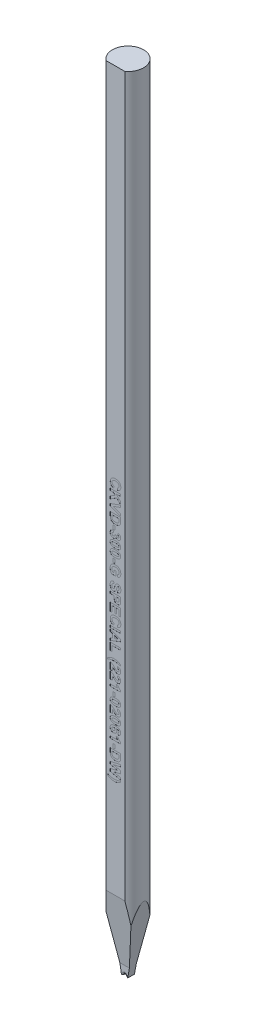
from build123d import *

# Parameters (mm, degrees)
SKETCH_TL_CUTTING_R       = 1.4986
TL_CUTTING_DEPTH          = 75.9968
SKETCH_TDF_GRINDING_W     = 3.0172
SKETCH_TDF_GRINDING_H     = 3.0172
TDF_GRINDING_DEPTH        = 77.026345527
SKETCH_ENGRAVING_W        = 0.166666667
SKETCH_ENGRAVING_H        = 0.371794872
SKETCH_ENGRAVING_W_2      = 1
SKETCH_ENGRAVING_H_2      = 0.192307693
ENGRAVING_DEPTH           = 0.005
VW_VR_GRINDING_DEPTH      = 1.5086
VW_VR_GRINDING_DEPTH_BACK = 1.5086
ISA_GRINDING_DEPTH        = 1.5086
ISA_GRINDING_DEPTH_BACK   = 1.5086
PRE_FRX_BRX_DEPTH         = 1.5086
PRE_FRX_BRX_DEPTH_BACK    = 1.5086
SKETCH_PRE_FRX_BRX_W      = 1.18348
SKETCH_PRE_FRX_BRX_H      = 0.89916
FR_EDM_R                  = 0.14986
BR_EDM_R                  = 0.14986
FA_BA_GRINDING_DEPTH      = 1.5086
FA_BA_GRINDING_DEPTH_BACK = 1.5086


with BuildPart() as part:
    # sketch_TL_cutting → TL_cutting (new body)
    with BuildSketch(Plane(origin=(0, 0, 0), x_dir=(1, 0, 0), z_dir=(0, 1, 0))):
        Circle(SKETCH_TL_CUTTING_R)
    extrude(amount=TL_CUTTING_DEPTH)

    # sketch_TDF_grinding → TDF_grinding (cut, through all)
    with BuildSketch(Plane(origin=(0, 0, 0), x_dir=(1, 0, 0), z_dir=(0, 1, 0))):
        with Locations((0, -2.71002)):
            Rectangle(SKETCH_TDF_GRINDING_W, SKETCH_TDF_GRINDING_H)
    extrude(amount=TDF_GRINDING_DEPTH, mode=Mode.SUBTRACT)

    # sketch_engraving → engraving (cut)
    # profile 1 of 31: a face of its own
    with BuildSketch(Plane.XY.offset(1.20142)):
        with BuildLine():
            Line((-0.128205128, 41.054650256), (-0.192307692, 40.862342564))
            add(Edge.make_bspline(
                [(-0.192307692, 40.862342564), (-0.204917923, 40.866249052), (-0.229612721, 40.873899184), (-0.2649877, 40.887977804), (-0.297871332, 40.903972008), (-0.328259475, 40.921799875), (-0.356049464, 40.941535258), (-0.381471598, 40.963029244), (-0.404368127, 40.986493424), (-0.424673345, 41.011910624), (-0.442633936, 41.039003711), (-0.457816548, 41.068096053), (-0.470893242, 41.09875117), (-0.481488041, 41.131280557), (-0.489972889, 41.165468151), (-0.495577171, 41.201474413), (-0.499377062, 41.239130896), (-0.499789062, 41.264843283), (-0.5, 41.278007628)],
                knots=[0, 0, 0, 0, 1.126670901, 2.206376047, 3.246533763, 4.245677351, 5.210506282, 6.152793389, 7.083980095, 8.004497442, 8.926231833, 9.854395169, 10.801995143, 11.768203916, 12.771938831, 13.805609698, 14.87650608, 16, 16, 16, 16], degree=3))
            add(Edge.make_bspline(
                [(-0.5, 41.278007628), (-0.499663994, 41.294256309), (-0.499003061, 41.326217949), (-0.492350465, 41.372959052), (-0.481969511, 41.417500328), (-0.467601869, 41.459909613), (-0.448555271, 41.499888786), (-0.42571373, 41.537813108), (-0.398318662, 41.573249391), (-0.367249987, 41.606390716), (-0.332452821, 41.636519196), (-0.294134751, 41.662512297), (-0.253074131, 41.685050491), (-0.208709772, 41.702976594), (-0.161353037, 41.717061791), (-0.110975156, 41.726908328), (-0.057578507, 41.733074942), (-0.020984357, 41.733777083), (-0.002203526, 41.734137436)],
                knots=[0, 0, 0, 0, 1.025134988, 2.016471176, 2.973446247, 3.909197306, 4.836872559, 5.763618465, 6.698581235, 7.658772073, 8.627106982, 9.597494692, 10.576422683, 11.578339294, 12.6118974, 13.690673505, 14.814808564, 16, 16, 16, 16], degree=3))
            add(Edge.make_bspline(
                [(-0.002203526, 41.734137436), (0.017576475, 41.7337692), (0.056163648, 41.733050839), (0.112313555, 41.727002878), (0.165084042, 41.716956768), (0.214577853, 41.703380058), (0.260470573, 41.685169249), (0.303160692, 41.663313909), (0.342311169, 41.637196152), (0.377833814, 41.607271091), (0.409480853, 41.574137852), (0.437377469, 41.538433428), (0.460593243, 41.499931041), (0.479896446, 41.459107336), (0.494630503, 41.415663397), (0.505304611, 41.369716602), (0.511505561, 41.321246054), (0.512376199, 41.28810808), (0.512820513, 41.271196731)],
                knots=[0, 0, 0, 0, 1.212773307, 2.365899439, 3.458117515, 4.504331001, 5.50806732, 6.480562534, 7.440239902, 8.387651817, 9.323121479, 10.245404239, 11.160468186, 12.07454208, 13.009500751, 13.96802424, 14.963018902, 16, 16, 16, 16], degree=3))
            add(Edge.make_bspline(
                [(0.512820513, 41.271196731), (0.512448361, 41.256427276), (0.511718707, 41.227469796), (0.506761415, 41.185064506), (0.498061698, 41.144876158), (0.486319015, 41.106687521), (0.470821797, 41.070715987), (0.451884357, 41.036897111), (0.429606892, 41.005114651), (0.412205553, 40.985965065), (0.403445513, 40.976324936)],
                knots=[0, 0, 0, 0, 1.098510076, 2.153775193, 3.169777012, 4.153122333, 5.120892526, 6.076995459, 7.031936742, 8, 8, 8, 8], degree=3))
            add(Edge.make_bspline(
                [(0.403445513, 40.976324936), (0.39787141, 40.970737644), (0.386592274, 40.959431818), (0.367549896, 40.944335368), (0.347050772, 40.930022058), (0.324745215, 40.916719068), (0.30046466, 40.904846849), (0.274581981, 40.893834097), (0.246997406, 40.883695069), (0.227800247, 40.878056604), (0.217948718, 40.875163077)],
                knots=[0, 0, 0, 0, 0.885292881, 1.791380647, 2.722937556, 3.69093542, 4.703306561, 5.754477758, 6.847650944, 8, 8, 8, 8], degree=3))
            Line((0.217948718, 40.875163077), (0.179487179, 41.067470769))
            add(Edge.make_bspline(
                [(0.179487179, 41.067470769), (0.1857949, 41.069105288), (0.198219456, 41.072324861), (0.21607256, 41.07883955), (0.233014714, 41.086311208), (0.248625569, 41.0955761), (0.263619506, 41.105402074), (0.277222328, 41.117064773), (0.290109132, 41.129569754), (0.301694454, 41.143458861), (0.312145605, 41.158333589), (0.321339918, 41.174043983), (0.329014435, 41.190628478), (0.335156827, 41.207961754), (0.340319842, 41.225985702), (0.34350638, 41.244872147), (0.345953545, 41.264455752), (0.3460861, 41.277798875), (0.346153846, 41.284618205)],
                knots=[0, 0, 0, 0, 1.051114734, 2.070420253, 3.064047898, 4.034553068, 4.997066449, 5.953344811, 6.921213386, 7.892675544, 8.867420182, 9.852654213, 10.826683617, 11.811917648, 12.818610352, 13.848120519, 14.900229319, 16, 16, 16, 16], degree=3))
            add(Edge.make_bspline(
                [(0.346153846, 41.284618205), (0.345958725, 41.293982256), (0.345576529, 41.31232423), (0.341532101, 41.33905448), (0.335695112, 41.364495692), (0.326982094, 41.38855706), (0.315677399, 41.411171698), (0.302244603, 41.432668905), (0.286035184, 41.452500806), (0.26758257, 41.471139764), (0.246135655, 41.487847721), (0.221779967, 41.502550652), (0.194212535, 41.514744121), (0.163711493, 41.524644409), (0.130202077, 41.532436736), (0.093641969, 41.538001162), (0.054005962, 41.541078434), (0.026581025, 41.541573903), (0.012419872, 41.541829744)],
                knots=[0, 0, 0, 0, 0.93816214, 1.837638998, 2.704791736, 3.551915875, 4.396257554, 5.235807848, 6.087970119, 6.959042444, 7.860386085, 8.80649345, 9.804409709, 10.875695391, 12.017327537, 13.250155505, 14.580089023, 16, 16, 16, 16], degree=3))
            add(Edge.make_bspline(
                [(0.012419872, 41.541829744), (-0.002609028, 41.541576423), (-0.031567402, 41.541088312), (-0.073337178, 41.538011685), (-0.111754322, 41.532411705), (-0.14688701, 41.524722849), (-0.178713725, 41.514772973), (-0.207179389, 41.502599106), (-0.23231734, 41.488126701), (-0.254110839, 41.471378275), (-0.272831387, 41.452777256), (-0.288926796, 41.432827439), (-0.302688307, 41.411646524), (-0.314010391, 41.389107053), (-0.322575422, 41.365123298), (-0.328786932, 41.339892371), (-0.332735688, 41.313321695), (-0.333131326, 41.295115799), (-0.333333333, 41.285820128)],
                knots=[0, 0, 0, 0, 1.475208372, 2.842499301, 4.107722225, 5.282836115, 6.369007568, 7.375918121, 8.315702116, 9.208439171, 10.065831443, 10.90006451, 11.71996243, 12.54067204, 13.369972975, 14.214060185, 15.088124569, 16, 16, 16, 16], degree=3))
            add(Edge.make_bspline(
                [(-0.333333333, 41.285820128), (-0.333161634, 41.278937953), (-0.332824013, 41.265405176), (-0.330681155, 41.245402689), (-0.326591822, 41.22620438), (-0.321184418, 41.207716281), (-0.314399721, 41.189866559), (-0.305696319, 41.17292748), (-0.295693052, 41.156565777), (-0.283969989, 41.14112094), (-0.270808612, 41.126386156), (-0.255597341, 41.112947159), (-0.238701667, 41.100481373), (-0.220008678, 41.089146947), (-0.199678377, 41.07856516), (-0.177394008, 41.069562121), (-0.153515697, 41.061174984), (-0.136789345, 41.056863153), (-0.128205128, 41.054650256)],
                knots=[0, 0, 0, 0, 0.980177776, 1.927374078, 2.859849964, 3.771585772, 4.668674471, 5.574490016, 6.479656464, 7.396337719, 8.332153134, 9.288470092, 10.28125149, 11.318486971, 12.398724812, 13.541284404, 14.738150009, 16, 16, 16, 16], degree=3))
        make_face()
    # profile 2 of 31: a face of its own
    with BuildSketch(Plane.XY.offset(1.20142)):
        Polygon((-0.5, 40.695675897), (0.5, 40.695675897), (0.5, 40.503368205), (0.052283654, 40.503368205), (0.5, 40.081693526), (0.5, 39.817470769), (0.11338141, 40.197278462), (-0.5, 39.804650256), (-0.5, 40.060860192), (-0.035456731, 40.343111795), (-0.198517628, 40.503368205), (-0.5, 40.503368205), align=None)
    # profile 3 of 31: a face of its own
    with BuildSketch(Plane.XY.offset(1.20142)):
        Polygon((-0.5, 39.428448333), (0.5, 39.79824), (0.5, 39.595115), (-0.243589744, 39.330291282), (0.5, 39.066469167), (0.5, 38.862342564), (-0.5, 39.230731987), align=None)
    # profile 4 of 31: a face of its own
    with BuildSketch(Plane.XY.offset(1.20142)):
        with BuildLine():
            Line((0.5, 38.772598974), (0.5, 38.405812115))
            add(Edge.make_bspline(
                [(0.5, 38.405812115), (0.500005193, 38.395794571), (0.500015306, 38.376288084), (0.498840892, 38.347979066), (0.497659587, 38.321506494), (0.495294873, 38.296946352), (0.492816233, 38.274213432), (0.489678088, 38.253266942), (0.485656212, 38.234239202), (0.482484481, 38.222240319), (0.480969551, 38.216509231)],
                knots=[0, 0, 0, 0, 1.259756885, 2.453039283, 3.563158368, 4.591894114, 5.55549294, 6.43918076, 7.254497783, 8, 8, 8, 8], degree=3))
            add(Edge.make_bspline(
                [(0.480969551, 38.216509231), (0.478637325, 38.209340254), (0.474014881, 38.195131431), (0.465827813, 38.174278378), (0.455960096, 38.154444479), (0.445111978, 38.135169819), (0.432903728, 38.116897553), (0.419595761, 38.099182873), (0.404753223, 38.082549803), (0.383633179, 38.06101514), (0.35420815, 38.036590255), (0.315375005, 38.01075972), (0.272594656, 37.989022014), (0.234409605, 37.973830641), (0.20183843, 37.963786542), (0.175754603, 37.957218141), (0.148301213, 37.951546468), (0.119383738, 37.947296292), (0.08913491, 37.943634906), (0.057465542, 37.941007238), (0.024383276, 37.93970625), (0.001870575, 37.939414494), (-0.009615385, 37.939265641)],
                knots=[0, 0, 0, 0, 0.745431882, 1.477436776, 2.212739876, 2.934276521, 3.663147754, 4.384200836, 5.123377481, 5.865761747, 7.365547505, 8.894711587, 10.468722596, 12.101948761, 12.951987285, 13.837595333, 14.760899389, 15.722756883, 16.726861385, 17.773652936, 18.864119771, 20, 20, 20, 20], degree=3))
            add(Edge.make_bspline(
                [(-0.009615385, 37.939265641), (-0.0294616, 37.939657046), (-0.067834928, 37.94041384), (-0.123301552, 37.946011211), (-0.17465514, 37.955306648), (-0.206804138, 37.965017075), (-0.222355769, 37.969714359)],
                knots=[0, 0, 0, 0, 1.103491527, 2.133638164, 3.0971734, 4, 4, 4, 4], degree=3))
            add(Edge.make_bspline(
                [(-0.222355769, 37.969714359), (-0.231274521, 37.972888003), (-0.248819098, 37.979131057), (-0.274127236, 37.990055932), (-0.298211673, 38.001860337), (-0.321053432, 38.014642184), (-0.342549771, 38.028466052), (-0.362636394, 38.043383645), (-0.381577746, 38.059163731), (-0.393236239, 38.07059549), (-0.399038462, 38.076284872)],
                knots=[0, 0, 0, 0, 1.090884612, 2.145940218, 3.175104604, 4.181306866, 5.161203701, 6.118658341, 7.063689906, 8, 8, 8, 8], degree=3))
            add(Edge.make_bspline(
                [(-0.399038462, 38.076284872), (-0.407300305, 38.085571145), (-0.424264154, 38.104638431), (-0.445652736, 38.13798995), (-0.464086504, 38.175865276), (-0.473760833, 38.203179168), (-0.478766026, 38.217310513)],
                knots=[0, 0, 0, 0, 0.912008655, 1.872605891, 2.89935344, 4, 4, 4, 4], degree=3))
            add(Edge.make_bspline(
                [(-0.478766026, 38.217310513), (-0.4805228, 38.223030486), (-0.484168894, 38.234901996), (-0.488062998, 38.253725444), (-0.492165475, 38.273819947), (-0.49463687, 38.295417223), (-0.497243066, 38.318293081), (-0.498706299, 38.342629822), (-0.49974511, 38.368343081), (-0.499913777, 38.385979175), (-0.5, 38.394994808)],
                knots=[0, 0, 0, 0, 0.799129865, 1.658552685, 2.566799617, 3.538529252, 4.561352959, 5.643373779, 6.795284424, 8, 8, 8, 8], degree=3))
            Line((-0.5, 38.394994808), (-0.5, 38.772598974))
            Line((-0.5, 38.772598974), (0.5, 38.772598974))
        make_face()
        with BuildLine():
            Line((0.333333333, 38.580291282), (-0.333333333, 38.580291282))
            Line((-0.333333333, 38.580291282), (-0.333333333, 38.422038077))
            add(Edge.make_bspline(
                [(-0.333333333, 38.422038077), (-0.333276671, 38.41489336), (-0.333167574, 38.401137049), (-0.332847006, 38.381231316), (-0.331979167, 38.362938115), (-0.331080228, 38.346161614), (-0.329595022, 38.33094549), (-0.328134266, 38.317223535), (-0.326090699, 38.305072132), (-0.324477534, 38.297567127), (-0.323717949, 38.294033269)],
                knots=[0, 0, 0, 0, 1.333384787, 2.567275092, 3.714769766, 4.750907381, 5.701951617, 6.567520054, 7.325492842, 8, 8, 8, 8], degree=3))
            add(Edge.make_bspline(
                [(-0.323717949, 38.294033269), (-0.321509316, 38.285756575), (-0.317207482, 38.269635757), (-0.307617456, 38.247000499), (-0.296048139, 38.226518507), (-0.282136533, 38.20784677), (-0.26455548, 38.19101967), (-0.242070693, 38.176655683), (-0.215254411, 38.163362192), (-0.189584523, 38.154258806), (-0.16665678, 38.147724413), (-0.147412959, 38.143301165), (-0.126593091, 38.139805591), (-0.104279343, 38.136798942), (-0.080500412, 38.134369499), (-0.055170426, 38.132857784), (-0.028320392, 38.131826029), (-0.009883527, 38.131659161), (-0.000400641, 38.131573333)],
                knots=[0, 0, 0, 0, 1.038686998, 2.023088296, 2.974059649, 3.888265163, 4.839857954, 5.909819677, 7.113156087, 8.466843969, 9.20827164, 10.006482943, 10.861893492, 11.769681931, 12.739021491, 13.762258324, 14.849031541, 16, 16, 16, 16], degree=3))
            add(Edge.make_bspline(
                [(-0.000400641, 38.131573333), (0.009082275, 38.1316585), (0.027452469, 38.131823485), (0.054102292, 38.132853664), (0.079033415, 38.134356863), (0.102276578, 38.136803691), (0.123864169, 38.139763456), (0.143813574, 38.143300891), (0.161996804, 38.147694423), (0.183589283, 38.154247511), (0.207947697, 38.164084996), (0.23429421, 38.177911199), (0.2571147, 38.194176402), (0.276689574, 38.212531558), (0.29287817, 38.233618569), (0.306422028, 38.256989371), (0.316938162, 38.283120279), (0.321416742, 38.301709318), (0.323717949, 38.311260833)],
                knots=[0, 0, 0, 0, 1.118059345, 2.165891593, 3.144157881, 4.062285166, 4.920717571, 5.712910489, 6.449981617, 7.12489426, 8.371943983, 9.541298068, 10.624898781, 11.666293176, 12.69306237, 13.747704633, 14.842713931, 16, 16, 16, 16], degree=3))
            add(Edge.make_bspline(
                [(0.323717949, 38.311260833), (0.324486218, 38.315395143), (0.326177652, 38.324497311), (0.328151987, 38.339601571), (0.329628909, 38.357388179), (0.331099472, 38.377817116), (0.331977905, 38.400867064), (0.332859431, 38.426572571), (0.333166326, 38.454956851), (0.333276065, 38.474789207), (0.333333333, 38.485139038)],
                knots=[0, 0, 0, 0, 0.578739524, 1.274162912, 2.095457587, 3.035141998, 4.093102578, 5.270121571, 6.575369351, 8, 8, 8, 8], degree=3))
            Line((0.333333333, 38.485139038), (0.333333333, 38.580291282))
        make_face(mode=Mode.SUBTRACT)
    # profile 5 of 31: a face of its own
    with BuildSketch(Plane.XY.offset(1.20142)):
        with Locations((-0.147435898, 37.612342564)):
            Rectangle(SKETCH_ENGRAVING_W, SKETCH_ENGRAVING_H)
    # profile 6 of 31: a face of its own
    with BuildSketch(Plane.XY.offset(1.20142)):
        with BuildLine():
            Line((-0.215945513, 37.362342564), (-0.192307692, 37.170034872))
            add(Edge.make_bspline(
                [(-0.192307692, 37.170034872), (-0.204132194, 37.168374047), (-0.226576764, 37.165221568), (-0.25764429, 37.155392911), (-0.284674848, 37.142559233), (-0.306838708, 37.125577778), (-0.324372016, 37.10595589), (-0.33711688, 37.08413994), (-0.34490548, 37.060107347), (-0.345732378, 37.043356439), (-0.346153846, 37.034818526)],
                knots=[0, 0, 0, 0, 1.266221457, 2.403466716, 3.446976871, 4.428566981, 5.347951143, 6.225000641, 7.095285456, 8, 8, 8, 8], degree=3))
            add(Edge.make_bspline(
                [(-0.346153846, 37.034818526), (-0.346055611, 37.030203461), (-0.345861023, 37.021061738), (-0.343788926, 37.007629506), (-0.340465357, 36.994758943), (-0.335437029, 36.982571108), (-0.329556159, 36.970826661), (-0.32227181, 36.959576899), (-0.313281658, 36.949262443), (-0.303428531, 36.939199798), (-0.292217285, 36.930268114), (-0.280052259, 36.922400902), (-0.267055651, 36.915494907), (-0.252891939, 36.910142089), (-0.237868043, 36.905952024), (-0.221918716, 36.902956531), (-0.205104086, 36.901133476), (-0.193581061, 36.900915398), (-0.187700321, 36.900804103)],
                knots=[0, 0, 0, 0, 0.951793398, 1.885354025, 2.797928458, 3.688489604, 4.600647717, 5.506538063, 6.445271935, 7.419741996, 8.409776722, 9.395967385, 10.406883209, 11.440832221, 12.514165763, 13.622322902, 14.786559767, 16, 16, 16, 16], degree=3))
            add(Edge.make_bspline(
                [(-0.187700321, 36.900804103), (-0.176786947, 36.901222422), (-0.155968497, 36.902020413), (-0.126418152, 36.908146809), (-0.100528778, 36.918853017), (-0.078485293, 36.933531647), (-0.060832569, 36.951320913), (-0.047691388, 36.971330944), (-0.040013472, 36.993554606), (-0.038982665, 37.008987528), (-0.038461538, 37.016789679)],
                knots=[0, 0, 0, 0, 1.241181749, 2.367689556, 3.413199457, 4.409869786, 5.360751057, 6.245864667, 7.113192516, 8, 8, 8, 8], degree=3))
            add(Edge.make_bspline(
                [(-0.038461538, 37.016789679), (-0.038603641, 37.022343112), (-0.038904883, 37.034115803), (-0.04203482, 37.052427586), (-0.046354275, 37.072396665), (-0.050509304, 37.08599409), (-0.052684295, 37.093111795)],
                knots=[0, 0, 0, 0, 0.854525515, 1.811503923, 2.854410343, 4, 4, 4, 4], degree=3))
            Line((-0.052684295, 37.093111795), (0.102564103, 37.075082949))
            add(Edge.make_bspline(
                [(0.102564103, 37.075082949), (0.102472429, 37.069738846), (0.102294537, 37.059368639), (0.103550083, 37.044225032), (0.10584242, 37.03005013), (0.10956176, 37.016877094), (0.114073964, 37.004693353), (0.119743619, 36.99339343), (0.126797738, 36.983249885), (0.137452935, 36.970914156), (0.153346669, 36.958212172), (0.175381237, 36.947159273), (0.200195104, 36.940403806), (0.217704887, 36.939653684), (0.226762821, 36.939265641)],
                knots=[0, 0, 0, 0, 0.916921599, 1.779281976, 2.604591006, 3.377627834, 4.124827521, 4.832199257, 5.541147775, 6.239830602, 7.625300353, 8.999010263, 10.447566839, 12, 12, 12, 12], degree=3))
            add(Edge.make_bspline(
                [(0.226762821, 36.939265641), (0.234476764, 36.939516334), (0.249283176, 36.939997523), (0.270180788, 36.945235916), (0.288882255, 36.953110608), (0.304586758, 36.964738575), (0.317487731, 36.978894609), (0.326781862, 36.995534939), (0.332438867, 37.014428834), (0.333026806, 37.027699453), (0.333333333, 37.034618205)],
                knots=[0, 0, 0, 0, 1.147344735, 2.202253707, 3.191599761, 4.153119954, 5.090433954, 6.026214277, 6.97094964, 8, 8, 8, 8], degree=3))
            add(Edge.make_bspline(
                [(0.333333333, 37.034618205), (0.332987648, 37.041548214), (0.332308151, 37.055170209), (0.325708071, 37.074638134), (0.315274673, 37.092481507), (0.300599014, 37.108350612), (0.282168696, 37.122049405), (0.259890756, 37.133006627), (0.233746812, 37.140438565), (0.214986903, 37.143031309), (0.205128205, 37.144393846)],
                knots=[0, 0, 0, 0, 0.89036141, 1.750142028, 2.61780756, 3.537452052, 4.514848764, 5.561443886, 6.71849122, 8, 8, 8, 8], degree=3))
            Line((0.205128205, 37.144393846), (0.233974359, 37.336701538))
            add(Edge.make_bspline(
                [(0.233974359, 37.336701538), (0.248657574, 37.333532323), (0.276764536, 37.327465734), (0.316129698, 37.315041503), (0.350961973, 37.300551687), (0.381387831, 37.283281655), (0.408215463, 37.263175814), (0.431647434, 37.23945335), (0.452006068, 37.21212244), (0.469141566, 37.181447941), (0.48286138, 37.148078807), (0.493019554, 37.112570657), (0.49884023, 37.075008376), (0.49960808, 37.049328246), (0.5, 37.036220769)],
                knots=[0, 0, 0, 0, 1.22092895, 2.337131514, 3.351677773, 4.283094182, 5.174661873, 6.069250129, 6.984703325, 7.937694494, 8.918809374, 9.912257166, 10.934388599, 12, 12, 12, 12], degree=3))
            add(Edge.make_bspline(
                [(0.5, 37.036220769), (0.499743324, 37.0250556), (0.499240363, 37.003177211), (0.494922998, 36.971182302), (0.487994845, 36.940826892), (0.478138042, 36.912212682), (0.465473847, 36.885270657), (0.449646388, 36.860247035), (0.431514029, 36.83650228), (0.417247021, 36.822516666), (0.41005609, 36.815467564)],
                knots=[0, 0, 0, 0, 1.090586174, 2.137027055, 3.148380755, 4.128502444, 5.088724121, 6.050075692, 7.017189, 8, 8, 8, 8], degree=3))
            add(Edge.make_bspline(
                [(0.41005609, 36.815467564), (0.403937931, 36.810014347), (0.391853934, 36.799243677), (0.372464834, 36.785292563), (0.352400741, 36.773505213), (0.33177098, 36.763951955), (0.310637907, 36.756191566), (0.288816497, 36.750784728), (0.26639464, 36.747489626), (0.251213033, 36.747135679), (0.243589744, 36.746957949)],
                knots=[0, 0, 0, 0, 1.065686435, 2.104841259, 3.101590809, 4.088754543, 5.058798532, 6.025881737, 7.008716709, 8, 8, 8, 8], degree=3))
            add(Edge.make_bspline(
                [(0.243589744, 36.746957949), (0.232867144, 36.747348156), (0.211730927, 36.748117325), (0.180999661, 36.75522324), (0.151856431, 36.7665429), (0.124562561, 36.782597174), (0.09868881, 36.802830588), (0.075169415, 36.828156452), (0.052695262, 36.857402269), (0.04001359, 36.879405891), (0.033453526, 36.890788077)],
                knots=[0, 0, 0, 0, 0.957658001, 1.887720032, 2.804751961, 3.743912922, 4.709136476, 5.731252806, 6.826406682, 8, 8, 8, 8], degree=3))
            add(Edge.make_bspline(
                [(0.033453526, 36.890788077), (0.031822372, 36.884015609), (0.028603533, 36.870651152), (0.022022537, 36.851354744), (0.01367829, 36.833297672), (0.004232675, 36.816115623), (-0.006542103, 36.799905765), (-0.018789165, 36.784713779), (-0.032819972, 36.770996037), (-0.047679673, 36.757892996), (-0.063887586, 36.746343284), (-0.081022983, 36.736311663), (-0.098866636, 36.727626197), (-0.117582182, 36.720614095), (-0.137087229, 36.715173972), (-0.157475267, 36.711446248), (-0.178623511, 36.708933745), (-0.193034825, 36.708643264), (-0.200320513, 36.70849641)],
                knots=[0, 0, 0, 0, 1.03751577, 2.047382676, 3.031239205, 3.997486026, 4.965932412, 5.927662117, 6.898405035, 7.88572577, 8.876798211, 9.857834218, 10.841137353, 11.829660183, 12.831310853, 13.853692922, 14.91492721, 16, 16, 16, 16], degree=3))
            add(Edge.make_bspline(
                [(-0.200320513, 36.70849641), (-0.2109584, 36.708712661), (-0.231937745, 36.709139137), (-0.2626715, 36.714114881), (-0.292387684, 36.721067328), (-0.320688592, 36.731725264), (-0.348018602, 36.744884593), (-0.373770643, 36.761552865), (-0.398719241, 36.780615045), (-0.421838487, 36.802791285), (-0.443209677, 36.82692231), (-0.461662849, 36.853023574), (-0.477734226, 36.880302651), (-0.490419897, 36.909287217), (-0.500667813, 36.939541873), (-0.507459472, 36.971416996), (-0.512114414, 37.004633455), (-0.512582989, 37.027323302), (-0.512820513, 37.038824936)],
                knots=[0, 0, 0, 0, 1.00633359, 1.984625146, 2.941575753, 3.891818189, 4.841976474, 5.80848851, 6.791183869, 7.810935832, 8.837000052, 9.838854168, 10.83333837, 11.829730352, 12.829487178, 13.852742075, 14.911540725, 16, 16, 16, 16], degree=3))
            add(Edge.make_bspline(
                [(-0.512820513, 37.038824936), (-0.512637793, 37.049723744), (-0.51227889, 37.07113157), (-0.508027091, 37.102470842), (-0.501772194, 37.132486869), (-0.492621954, 37.16100445), (-0.481351422, 37.188271997), (-0.466822586, 37.213774845), (-0.450309361, 37.238169476), (-0.430965435, 37.260658893), (-0.409882535, 37.281569186), (-0.386697234, 37.299936375), (-0.362149526, 37.316303988), (-0.336021778, 37.330381702), (-0.308246096, 37.342051545), (-0.278894175, 37.351138132), (-0.248055897, 37.35838486), (-0.226796469, 37.36100515), (-0.215945513, 37.362342564)],
                knots=[0, 0, 0, 0, 1.077528213, 2.11651914, 3.123276654, 4.10732375, 5.075386463, 6.036572488, 7.005896639, 7.98540975, 8.966414275, 9.939311093, 10.906719916, 11.882103104, 12.870994428, 13.882228509, 14.919075059, 16, 16, 16, 16], degree=3))
        make_face()
    # profile 7 of 31: a face of its own
    with BuildSketch(Plane.XY.offset(1.20142)):
        with BuildLine():
            add(Edge.make_bspline(
                [(0.5, 36.266188718), (0.49971384, 36.254284998), (0.499156721, 36.231109821), (0.494192381, 36.197347508), (0.486315205, 36.165594925), (0.474936732, 36.135845943), (0.460535804, 36.107949267), (0.442472771, 36.082297415), (0.421624591, 36.05829643), (0.405435577, 36.044440797), (0.397235577, 36.037422692)],
                knots=[0, 0, 0, 0, 1.098626248, 2.138899374, 3.143835643, 4.113754749, 5.073488057, 6.034745239, 7.004566348, 8, 8, 8, 8], degree=3))
            add(Edge.make_bspline(
                [(0.397235577, 36.037422692), (0.392013767, 36.033407993), (0.381356969, 36.025214695), (0.364136726, 36.01418029), (0.345869985, 36.003571685), (0.326116385, 35.994313442), (0.305221356, 35.985440078), (0.283126793, 35.977249313), (0.259707844, 35.97001695), (0.235071142, 35.963712124), (0.209179241, 35.957818627), (0.181968999, 35.952881398), (0.15350924, 35.948655972), (0.123831018, 35.945360738), (0.092992495, 35.942406339), (0.060842825, 35.940789757), (0.027454838, 35.939465267), (0.004742429, 35.939332949), (-0.006810897, 35.939265641)],
                knots=[0, 0, 0, 0, 0.746775751, 1.524038446, 2.317840886, 3.141016509, 3.996283186, 4.892488336, 5.812382473, 6.774967264, 7.776368117, 8.823659909, 9.910833035, 11.039122168, 12.210293276, 13.424012874, 14.68964937, 16, 16, 16, 16], degree=3))
            add(Edge.make_bspline(
                [(-0.006810897, 35.939265641), (-0.01836425, 35.939331934), (-0.041009977, 35.939461876), (-0.074330982, 35.940794693), (-0.106413621, 35.942407781), (-0.13725379, 35.945353853), (-0.166926114, 35.948680728), (-0.195353975, 35.952786272), (-0.22243919, 35.958104764), (-0.248289812, 35.963911418), (-0.27303117, 35.970176077), (-0.296407841, 35.9777299), (-0.318777777, 35.985590303), (-0.339699687, 35.994669898), (-0.359477735, 36.004260372), (-0.377930928, 36.014711112), (-0.395257891, 36.025868726), (-0.40597091, 36.034141289), (-0.411258013, 36.038223974)],
                knots=[0, 0, 0, 0, 1.308411734, 2.564617834, 3.776541518, 4.94597967, 6.0725993, 7.15816376, 8.197872509, 9.197791611, 10.158952087, 11.086962723, 11.979249638, 12.843171697, 13.668427753, 14.467630577, 15.243743175, 16, 16, 16, 16], degree=3))
            add(Edge.make_bspline(
                [(-0.411258013, 36.038223974), (-0.419387722, 36.045177875), (-0.435436162, 36.058905209), (-0.456111536, 36.082640465), (-0.473801555, 36.1082509), (-0.487914093, 36.136097064), (-0.499368982, 36.165701236), (-0.506993451, 36.197505546), (-0.511967929, 36.231175616), (-0.512532265, 36.254351213), (-0.512820513, 36.266188718)],
                knots=[0, 0, 0, 0, 0.991667276, 1.957599061, 2.911530233, 3.873218945, 4.847995157, 5.850445929, 6.902062539, 8, 8, 8, 8], degree=3))
            add(Edge.make_bspline(
                [(-0.512820513, 36.266188718), (-0.512476011, 36.278161133), (-0.511800941, 36.301621702), (-0.506449472, 36.335875149), (-0.497876451, 36.368434622), (-0.485636462, 36.399183234), (-0.469774335, 36.428076989), (-0.45076002, 36.455341616), (-0.427732542, 36.480383948), (-0.40629523, 36.499989361), (-0.386925042, 36.514332741), (-0.37086259, 36.524449036), (-0.353675124, 36.534225358), (-0.33482528, 36.542663499), (-0.314870578, 36.550988475), (-0.293380967, 36.558361787), (-0.270541238, 36.564866959), (-0.246455682, 36.570974901), (-0.220958398, 36.576068025), (-0.194124629, 36.580752952), (-0.165840258, 36.584444927), (-0.136262825, 36.587718243), (-0.105322509, 36.590022844), (-0.073069943, 36.591894475), (-0.039401887, 36.592832969), (-0.01649349, 36.593017608), (-0.004807692, 36.593111795)],
                knots=[0, 0, 0, 0, 1.257818097, 2.464759732, 3.634271214, 4.790227596, 5.933394726, 7.09190477, 8.274482889, 9.50191983, 10.139172818, 10.805000628, 11.49619854, 12.215266328, 12.973768034, 13.768328009, 14.601232062, 15.469317089, 16.379095881, 17.333267023, 18.331755967, 19.376479622, 20.460535752, 21.592206075, 22.771760786, 24, 24, 24, 24], degree=3))
            add(Edge.make_bspline(
                [(-0.004807692, 36.593111795), (0.006678925, 36.593046), (0.02919122, 36.592917052), (0.062378132, 36.591574948), (0.094328674, 36.589981634), (0.12509981, 36.58700902), (0.154640959, 36.583709515), (0.183004063, 36.579596894), (0.209982531, 36.574178814), (0.235876189, 36.568829743), (0.260431507, 36.562089782), (0.2837906, 36.554664475), (0.306110518, 36.546830136), (0.326924245, 36.537657854), (0.346659803, 36.528122898), (0.365109758, 36.517664838), (0.382437536, 36.506509066), (0.39315045, 36.498236265), (0.3984375, 36.494153462)],
                knots=[0, 0, 0, 0, 1.304443357, 2.556541329, 3.771813033, 4.936929721, 6.066661712, 7.147723817, 8.190304831, 9.191350322, 10.149780912, 11.080355239, 11.975107155, 12.834450748, 13.66198663, 14.463397305, 15.241653965, 16, 16, 16, 16], degree=3))
            add(Edge.make_bspline(
                [(0.3984375, 36.494153462), (0.406566428, 36.487199179), (0.422613323, 36.473471089), (0.443299998, 36.449741361), (0.460913987, 36.424159209), (0.475197493, 36.396394301), (0.486497465, 36.366722107), (0.494183265, 36.334876121), (0.499144648, 36.301200686), (0.499710816, 36.278025839), (0.5, 36.266188718)],
                knots=[0, 0, 0, 0, 0.991631672, 1.957528776, 2.911425699, 3.867574088, 4.848108326, 5.850523106, 6.902101959, 8, 8, 8, 8], degree=3))
        make_face()
        with BuildLine():
            add(Edge.make_bspline(
                [(0.333333333, 36.266188718), (0.333068079, 36.272356684), (0.332548986, 36.284427158), (0.328316127, 36.301982094), (0.321759633, 36.318563165), (0.312130705, 36.334121206), (0.299093083, 36.34852978), (0.281476094, 36.360737658), (0.259881539, 36.371291162), (0.243736, 36.376570771), (0.235176282, 36.379369808)],
                knots=[0, 0, 0, 0, 0.909107913, 1.77908945, 2.650019014, 3.530482969, 4.465025013, 5.495890128, 6.672421267, 8, 8, 8, 8], degree=3))
            add(Edge.make_bspline(
                [(0.235176282, 36.379369808), (0.228718042, 36.381117997), (0.214837576, 36.384875317), (0.192206647, 36.38913972), (0.166522939, 36.392656485), (0.137792419, 36.395626038), (0.105999886, 36.398042628), (0.071125109, 36.399530848), (0.033192525, 36.400559478), (0.006878451, 36.400720391), (-0.006810897, 36.400804103)],
                knots=[0, 0, 0, 0, 0.658986521, 1.416336438, 2.266694271, 3.212608458, 4.261595115, 5.407496572, 6.651304179, 8, 8, 8, 8], degree=3))
            add(Edge.make_bspline(
                [(-0.006810897, 36.400804103), (-0.020433943, 36.400813117), (-0.046549094, 36.400830397), (-0.084006477, 36.399656163), (-0.118154033, 36.39848872), (-0.148991056, 36.396119061), (-0.176626244, 36.393780892), (-0.200847568, 36.390243343), (-0.221857789, 36.386690608), (-0.244486895, 36.380657153), (-0.268257705, 36.372341394), (-0.292448985, 36.361112977), (-0.311537375, 36.348447058), (-0.325415776, 36.333915587), (-0.334597404, 36.318170329), (-0.341538269, 36.301866395), (-0.345246665, 36.284314555), (-0.345848983, 36.272280013), (-0.346153846, 36.266188718)],
                knots=[0, 0, 0, 0, 1.613038927, 3.092168624, 4.43749063, 5.658264602, 6.75425577, 7.720394221, 8.556328411, 9.275513998, 10.490872946, 11.534172084, 12.42681833, 13.187531851, 13.88996177, 14.574222125, 15.278341114, 16, 16, 16, 16], degree=3))
            add(Edge.make_bspline(
                [(-0.346153846, 36.266188718), (-0.345874419, 36.26009088), (-0.345321688, 36.248028799), (-0.341225408, 36.230496833), (-0.334465655, 36.213939336), (-0.325029126, 36.198276493), (-0.311901617, 36.18385441), (-0.294300445, 36.171637614), (-0.272700888, 36.16108693), (-0.25655611, 36.155806893), (-0.247996795, 36.153007628)],
                knots=[0, 0, 0, 0, 0.899391665, 1.779078861, 2.640979247, 3.529945348, 4.464599804, 5.495588918, 6.672261578, 8, 8, 8, 8], degree=3))
            add(Edge.make_bspline(
                [(-0.247996795, 36.153007628), (-0.241538043, 36.151261968), (-0.227719754, 36.147527186), (-0.205229709, 36.143232396), (-0.179679092, 36.13970611), (-0.151079269, 36.136764791), (-0.11935541, 36.134324431), (-0.084546407, 36.132848845), (-0.046680798, 36.131819247), (-0.020433482, 36.131657356), (-0.006810897, 36.131573333)],
                knots=[0, 0, 0, 0, 0.66114423, 1.414496391, 2.261103113, 3.210114492, 4.255954433, 5.405607896, 6.653488082, 8, 8, 8, 8], degree=3))
            add(Edge.make_bspline(
                [(-0.006810897, 36.131573333), (0.006810741, 36.131687109), (0.032921137, 36.131905199), (0.070464093, 36.132532091), (0.104645163, 36.134287006), (0.13553417, 36.136043226), (0.163028833, 36.139008631), (0.187277888, 36.141951537), (0.208178651, 36.146023667), (0.23096624, 36.151615697), (0.254848985, 36.15995368), (0.278913284, 36.17152584), (0.298191428, 36.18396291), (0.312146257, 36.198469879), (0.321683592, 36.214188044), (0.328364426, 36.230640374), (0.332523972, 36.248089531), (0.333060584, 36.26008941), (0.333333333, 36.266188718)],
                knots=[0, 0, 0, 0, 1.611458614, 3.088895909, 4.441089836, 5.660086535, 6.747875232, 7.711965119, 8.548505902, 9.26500436, 10.486583113, 11.532259092, 12.419544583, 13.184925779, 13.890764661, 14.581638641, 15.279074115, 16, 16, 16, 16], degree=3))
        make_face(mode=Mode.SUBTRACT)
    # profile 8 of 31: a face of its own
    with BuildSketch(Plane.XY.offset(1.20142)):
        with BuildLine():
            add(Edge.make_bspline(
                [(0.5, 35.496957949), (0.49971384, 35.485054229), (0.499156721, 35.461879051), (0.494192381, 35.428116739), (0.486315205, 35.396364156), (0.474936732, 35.366615173), (0.460535804, 35.338718497), (0.442472771, 35.313066646), (0.421624591, 35.289065661), (0.405435577, 35.275210028), (0.397235577, 35.268191923)],
                knots=[0, 0, 0, 0, 1.098626248, 2.138899374, 3.143835643, 4.113754749, 5.073488057, 6.034745239, 7.004566348, 8, 8, 8, 8], degree=3))
            add(Edge.make_bspline(
                [(0.397235577, 35.268191923), (0.392013767, 35.264177224), (0.381356969, 35.255983926), (0.364136726, 35.24494952), (0.345869985, 35.234340915), (0.326116385, 35.225082673), (0.305221356, 35.216209309), (0.283126793, 35.208018544), (0.259707844, 35.20078618), (0.235071142, 35.194481354), (0.209179241, 35.188587858), (0.181968999, 35.183650628), (0.15350924, 35.179425203), (0.123831018, 35.176129969), (0.092992495, 35.17317557), (0.060842825, 35.171558988), (0.027454838, 35.170234498), (0.004742429, 35.170102179), (-0.006810897, 35.170034872)],
                knots=[0, 0, 0, 0, 0.746775751, 1.524038446, 2.317840886, 3.141016509, 3.996283186, 4.892488336, 5.812382473, 6.774967264, 7.776368117, 8.823659909, 9.910833035, 11.039122168, 12.210293276, 13.424012874, 14.68964937, 16, 16, 16, 16], degree=3))
            add(Edge.make_bspline(
                [(-0.006810897, 35.170034872), (-0.01836425, 35.170101165), (-0.041009977, 35.170231107), (-0.074330982, 35.171563924), (-0.106413621, 35.173177012), (-0.13725379, 35.176123084), (-0.166926114, 35.179449959), (-0.195353975, 35.183555503), (-0.22243919, 35.188873995), (-0.248289812, 35.194680649), (-0.27303117, 35.200945308), (-0.296407841, 35.208499131), (-0.318777777, 35.216359533), (-0.339699687, 35.225439129), (-0.359477735, 35.235029602), (-0.377930928, 35.245480342), (-0.395257891, 35.256637957), (-0.40597091, 35.26491052), (-0.411258013, 35.268993205)],
                knots=[0, 0, 0, 0, 1.308411734, 2.564617834, 3.776541518, 4.94597967, 6.0725993, 7.15816376, 8.197872509, 9.197791611, 10.158952087, 11.086962723, 11.979249638, 12.843171697, 13.668427753, 14.467630577, 15.243743175, 16, 16, 16, 16], degree=3))
            add(Edge.make_bspline(
                [(-0.411258013, 35.268993205), (-0.419387722, 35.275947105), (-0.435436162, 35.28967444), (-0.456111536, 35.313409695), (-0.473801555, 35.339020131), (-0.487914093, 35.366866295), (-0.499368982, 35.396470467), (-0.506993451, 35.428274777), (-0.511967929, 35.461944847), (-0.512532265, 35.485120444), (-0.512820513, 35.496957949)],
                knots=[0, 0, 0, 0, 0.991667276, 1.957599061, 2.911530233, 3.873218945, 4.847995157, 5.850445929, 6.902062539, 8, 8, 8, 8], degree=3))
            add(Edge.make_bspline(
                [(-0.512820513, 35.496957949), (-0.512476011, 35.508930364), (-0.511800941, 35.532390933), (-0.506449472, 35.566644379), (-0.497876451, 35.599203853), (-0.485636462, 35.629952465), (-0.469774335, 35.65884622), (-0.45076002, 35.686110847), (-0.427732542, 35.711153179), (-0.40629523, 35.730758592), (-0.386925042, 35.745101971), (-0.37086259, 35.755218267), (-0.353675124, 35.764994589), (-0.33482528, 35.77343273), (-0.314870578, 35.781757706), (-0.293380967, 35.789131018), (-0.270541238, 35.79563619), (-0.246455682, 35.801744132), (-0.220958398, 35.806837256), (-0.194124629, 35.811522183), (-0.165840258, 35.815214157), (-0.136262825, 35.818487473), (-0.105322509, 35.820792075), (-0.073069943, 35.822663706), (-0.039401887, 35.8236022), (-0.01649349, 35.823786839), (-0.004807692, 35.823881026)],
                knots=[0, 0, 0, 0, 1.257818097, 2.464759732, 3.634271214, 4.790227596, 5.933394726, 7.09190477, 8.274482889, 9.50191983, 10.139172818, 10.805000628, 11.49619854, 12.215266328, 12.973768034, 13.768328009, 14.601232062, 15.469317089, 16.379095881, 17.333267023, 18.331755967, 19.376479622, 20.460535752, 21.592206075, 22.771760786, 24, 24, 24, 24], degree=3))
            add(Edge.make_bspline(
                [(-0.004807692, 35.823881026), (0.006678925, 35.823815231), (0.02919122, 35.823686282), (0.062378132, 35.822344179), (0.094328674, 35.820750865), (0.12509981, 35.817778251), (0.154640959, 35.814478746), (0.183004063, 35.810366125), (0.209982531, 35.804948045), (0.235876189, 35.799598974), (0.260431507, 35.792859013), (0.2837906, 35.785433706), (0.306110518, 35.777599367), (0.326924245, 35.768427084), (0.346659803, 35.758892128), (0.365109758, 35.748434069), (0.382437536, 35.737278297), (0.39315045, 35.729005495), (0.3984375, 35.724922692)],
                knots=[0, 0, 0, 0, 1.304443357, 2.556541329, 3.771813033, 4.936929721, 6.066661712, 7.147723817, 8.190304831, 9.191350322, 10.149780912, 11.080355239, 11.975107155, 12.834450748, 13.66198663, 14.463397305, 15.241653965, 16, 16, 16, 16], degree=3))
            add(Edge.make_bspline(
                [(0.3984375, 35.724922692), (0.406566428, 35.71796841), (0.422613323, 35.70424032), (0.443299998, 35.680510592), (0.460913987, 35.654928439), (0.475197493, 35.627163532), (0.486497465, 35.597491338), (0.494183265, 35.565645352), (0.499144648, 35.531969916), (0.499710816, 35.50879507), (0.5, 35.496957949)],
                knots=[0, 0, 0, 0, 0.991631672, 1.957528776, 2.911425699, 3.867574088, 4.848108326, 5.850523106, 6.902101959, 8, 8, 8, 8], degree=3))
        make_face()
        with BuildLine():
            add(Edge.make_bspline(
                [(0.333333333, 35.496957949), (0.333068079, 35.503125915), (0.332548986, 35.515196389), (0.328316127, 35.532751325), (0.321759633, 35.549332396), (0.312130705, 35.564890436), (0.299093083, 35.579299011), (0.281476094, 35.591506888), (0.259881539, 35.602060392), (0.243736, 35.607340001), (0.235176282, 35.610139038)],
                knots=[0, 0, 0, 0, 0.909107913, 1.77908945, 2.650019014, 3.530482969, 4.465025013, 5.495890128, 6.672421267, 8, 8, 8, 8], degree=3))
            add(Edge.make_bspline(
                [(0.235176282, 35.610139038), (0.228718042, 35.611887227), (0.214837576, 35.615644548), (0.192206647, 35.619908951), (0.166522939, 35.623425716), (0.137792419, 35.626395269), (0.105999886, 35.628811859), (0.071125109, 35.630300078), (0.033192525, 35.631328709), (0.006878451, 35.631489622), (-0.006810897, 35.631573333)],
                knots=[0, 0, 0, 0, 0.658986521, 1.416336438, 2.266694271, 3.212608458, 4.261595115, 5.407496572, 6.651304179, 8, 8, 8, 8], degree=3))
            add(Edge.make_bspline(
                [(-0.006810897, 35.631573333), (-0.020433943, 35.631582347), (-0.046549094, 35.631599627), (-0.084006477, 35.630425394), (-0.118154033, 35.629257951), (-0.148991056, 35.626888292), (-0.176626244, 35.624550123), (-0.200847568, 35.621012574), (-0.221857789, 35.617459839), (-0.244486895, 35.611426384), (-0.268257705, 35.603110625), (-0.292448985, 35.591882207), (-0.311537375, 35.579216289), (-0.325415776, 35.564684818), (-0.334597404, 35.54893956), (-0.341538269, 35.532635625), (-0.345246665, 35.515083786), (-0.345848983, 35.503049244), (-0.346153846, 35.496957949)],
                knots=[0, 0, 0, 0, 1.613038927, 3.092168624, 4.43749063, 5.658264602, 6.75425577, 7.720394221, 8.556328411, 9.275513998, 10.490872946, 11.534172084, 12.42681833, 13.187531851, 13.88996177, 14.574222125, 15.278341114, 16, 16, 16, 16], degree=3))
            add(Edge.make_bspline(
                [(-0.346153846, 35.496957949), (-0.345874419, 35.490860111), (-0.345321688, 35.47879803), (-0.341225408, 35.461266063), (-0.334465655, 35.444708567), (-0.325029126, 35.429045723), (-0.311901617, 35.414623641), (-0.294300445, 35.402406845), (-0.272700888, 35.391856161), (-0.25655611, 35.386576123), (-0.247996795, 35.383776859)],
                knots=[0, 0, 0, 0, 0.899391665, 1.779078861, 2.640979247, 3.529945348, 4.464599804, 5.495588918, 6.672261578, 8, 8, 8, 8], degree=3))
            add(Edge.make_bspline(
                [(-0.247996795, 35.383776859), (-0.241538043, 35.382031199), (-0.227719754, 35.378296417), (-0.205229709, 35.374001627), (-0.179679092, 35.37047534), (-0.151079269, 35.367534022), (-0.11935541, 35.365093662), (-0.084546407, 35.363618076), (-0.046680798, 35.362588478), (-0.020433482, 35.362426587), (-0.006810897, 35.362342564)],
                knots=[0, 0, 0, 0, 0.66114423, 1.414496391, 2.261103113, 3.210114492, 4.255954433, 5.405607896, 6.653488082, 8, 8, 8, 8], degree=3))
            add(Edge.make_bspline(
                [(-0.006810897, 35.362342564), (0.006810741, 35.36245634), (0.032921137, 35.36267443), (0.070464093, 35.363301322), (0.104645163, 35.365056237), (0.13553417, 35.366812457), (0.163028833, 35.369777861), (0.187277888, 35.372720768), (0.208178651, 35.376792897), (0.23096624, 35.382384928), (0.254848985, 35.39072291), (0.278913284, 35.402295071), (0.298191428, 35.414732141), (0.312146257, 35.42923911), (0.321683592, 35.444957274), (0.328364426, 35.461409605), (0.332523972, 35.478858762), (0.333060584, 35.490858641), (0.333333333, 35.496957949)],
                knots=[0, 0, 0, 0, 1.611458614, 3.088895909, 4.441089836, 5.660086535, 6.747875232, 7.711965119, 8.548505902, 9.26500436, 10.486583113, 11.532259092, 12.419544583, 13.184925779, 13.890764661, 14.581638641, 15.279074115, 16, 16, 16, 16], degree=3))
        make_face(mode=Mode.SUBTRACT)
    # profile 9 of 31: a face of its own
    with BuildSketch(Plane.XY.offset(1.20142)):
        with Locations((-0.147435898, 34.843111795)):
            Rectangle(SKETCH_ENGRAVING_W, SKETCH_ENGRAVING_H)
    # profile 10 of 31: a face of its own
    with BuildSketch(Plane.XY.offset(1.20142)):
        with BuildLine():
            Line((-0.128205128, 34.093111795), (0.038461538, 34.093111795))
            Line((0.038461538, 34.093111795), (0.038461538, 33.657214359))
            Line((0.038461538, 33.657214359), (-0.36338141, 33.657214359))
            add(Edge.make_bspline(
                [(-0.36338141, 33.657214359), (-0.368321434, 33.662700375), (-0.378419843, 33.6739149), (-0.392661125, 33.692212664), (-0.406257259, 33.712356779), (-0.4194836, 33.734225469), (-0.432233696, 33.757863992), (-0.444685123, 33.783178064), (-0.45671611, 33.810214391), (-0.471787381, 33.848447711), (-0.488186169, 33.89766183), (-0.502445448, 33.957827076), (-0.511191227, 34.018468267), (-0.512277771, 34.059029075), (-0.512820513, 34.079289679)],
                knots=[0, 0, 0, 0, 0.581799769, 1.189316438, 1.825828404, 2.496525428, 3.203088405, 3.942228803, 4.719818701, 5.534979611, 7.181138583, 8.803804008, 10.403462225, 12, 12, 12, 12], degree=3))
            add(Edge.make_bspline(
                [(-0.512820513, 34.079289679), (-0.512629241, 34.091982166), (-0.512252188, 34.117002831), (-0.509233571, 34.153941118), (-0.504017902, 34.189658224), (-0.496780719, 34.224090736), (-0.487836372, 34.257341646), (-0.476607913, 34.289294166), (-0.463065488, 34.319914068), (-0.447986133, 34.349430581), (-0.430657849, 34.377283177), (-0.411724289, 34.403527023), (-0.390891397, 34.427907404), (-0.36853351, 34.450636217), (-0.344060025, 34.471284803), (-0.318106216, 34.490366641), (-0.290219674, 34.507425038), (-0.260879177, 34.522751559), (-0.230317098, 34.536380942), (-0.198781008, 34.547883246), (-0.166726875, 34.557966922), (-0.134042675, 34.566254707), (-0.10062201, 34.572341654), (-0.066619552, 34.577073529), (-0.031822841, 34.579615004), (-0.008417054, 34.580064325), (0.003405449, 34.580291282)],
                knots=[0, 0, 0, 0, 1.124897971, 2.217508473, 3.282174662, 4.322209414, 5.334422951, 6.332119154, 7.320662553, 8.300074908, 9.267468154, 10.225199689, 11.165658754, 12.107290334, 13.047749399, 14.00069605, 14.959944213, 15.942088746, 16.933021067, 17.923599838, 18.915715637, 19.910475908, 20.909926025, 21.925232038, 22.952013513, 24, 24, 24, 24], degree=3))
            add(Edge.make_bspline(
                [(0.003405449, 34.580291282), (0.016165747, 34.580107383), (0.041321811, 34.579744838), (0.078501182, 34.576615194), (0.114594914, 34.571767239), (0.149519517, 34.564372247), (0.183523729, 34.555518796), (0.216299841, 34.544174109), (0.248180515, 34.531220661), (0.278688999, 34.515936543), (0.308028284, 34.499053971), (0.335510174, 34.4798704), (0.361403632, 34.4590508), (0.385591047, 34.436407968), (0.407627145, 34.411569007), (0.428063784, 34.385043308), (0.447146094, 34.35684846), (0.457908016, 34.336671736), (0.463341346, 34.326485192)],
                knots=[0, 0, 0, 0, 1.105132952, 2.178694671, 3.229818344, 4.257558797, 5.269123684, 6.27148554, 7.259679084, 8.247804916, 9.224967877, 10.189258471, 11.147685264, 12.101072275, 13.055511435, 14.02039165, 15.000562851, 16, 16, 16, 16], degree=3))
            add(Edge.make_bspline(
                [(0.463341346, 34.326485192), (0.467347168, 34.318397841), (0.475455657, 34.302027618), (0.485329628, 34.275954525), (0.494054347, 34.248586948), (0.500719187, 34.219605473), (0.506115234, 34.189318993), (0.510216979, 34.157577917), (0.512307439, 34.124323708), (0.512647258, 34.101661284), (0.512820513, 34.090106987)],
                knots=[0, 0, 0, 0, 0.887950456, 1.797368171, 2.741221183, 3.713797788, 4.722103116, 5.768966405, 6.862521341, 8, 8, 8, 8], degree=3))
            add(Edge.make_bspline(
                [(0.512820513, 34.090106987), (0.512598613, 34.075209487), (0.512167059, 34.046236604), (0.508571106, 34.00399631), (0.502373597, 33.964242674), (0.493837942, 33.926920334), (0.482863355, 33.892109697), (0.469371425, 33.859870687), (0.453633675, 33.830005429), (0.435019378, 33.802946485), (0.414494937, 33.778143918), (0.392035387, 33.755662449), (0.367607461, 33.735493031), (0.341334074, 33.717622318), (0.313106625, 33.702190967), (0.283182558, 33.688922952), (0.251334696, 33.678001769), (0.22921692, 33.672723803), (0.217948718, 33.670034872)],
                knots=[0, 0, 0, 0, 1.271135529, 2.472123572, 3.614091059, 4.701890498, 5.736279567, 6.724681829, 7.680621489, 8.611506429, 9.52200816, 10.424540711, 11.318996785, 12.221421405, 13.131851814, 14.060431888, 15.011860567, 16, 16, 16, 16], degree=3))
            Line((0.217948718, 33.670034872), (0.179487179, 33.862342564))
            add(Edge.make_bspline(
                [(0.179487179, 33.862342564), (0.185798707, 33.864245146), (0.198251232, 33.867998905), (0.216108293, 33.875305481), (0.232994438, 33.883623603), (0.248643132, 33.893450597), (0.263649233, 33.903888251), (0.277161531, 33.916158435), (0.290187329, 33.929065453), (0.301701762, 33.943556609), (0.312086782, 33.958995164), (0.321450083, 33.975216632), (0.329043783, 33.992584974), (0.335153652, 34.010857597), (0.340342569, 34.029945002), (0.343533767, 34.05009634), (0.345940549, 34.0710853), (0.346081986, 34.085425325), (0.346153846, 34.092711154)],
                knots=[0, 0, 0, 0, 1.027780279, 2.027791312, 3.006028774, 3.96000864, 4.908113241, 5.852721087, 6.802883308, 7.765918715, 8.733730415, 9.704005314, 10.683351261, 11.68471758, 12.707948499, 13.764514378, 14.864202456, 16, 16, 16, 16], degree=3))
            add(Edge.make_bspline(
                [(0.346153846, 34.092711154), (0.345859633, 34.103738511), (0.34528545, 34.125259337), (0.341538784, 34.156676876), (0.334873123, 34.186316442), (0.325679114, 34.21425554), (0.313877959, 34.240545391), (0.299029501, 34.264830737), (0.282012344, 34.28771627), (0.262039987, 34.308550747), (0.239645267, 34.32744525), (0.214561065, 34.343801822), (0.186868462, 34.357418599), (0.156706511, 34.368571515), (0.124073954, 34.377451616), (0.088855272, 34.383475764), (0.051104495, 34.387411833), (0.02505068, 34.387789093), (0.01161859, 34.38798359)],
                knots=[0, 0, 0, 0, 1.043810997, 2.037086103, 2.989314757, 3.91471467, 4.817033861, 5.710208705, 6.603920097, 7.511448416, 8.435617211, 9.371747005, 10.338444094, 11.350425613, 12.411431869, 13.5347293, 14.729025275, 16, 16, 16, 16], degree=3))
            add(Edge.make_bspline(
                [(0.01161859, 34.38798359), (-0.002813331, 34.387780916), (-0.03086261, 34.387387007), (-0.071503034, 34.383552106), (-0.109371212, 34.377253885), (-0.14440027, 34.368186527), (-0.176807311, 34.356879264), (-0.206438048, 34.342899735), (-0.233109204, 34.326091899), (-0.256980675, 34.307029064), (-0.278169336, 34.285992253), (-0.296147735, 34.262929293), (-0.31184176, 34.238671086), (-0.32420794, 34.212531286), (-0.33413508, 34.184982798), (-0.341078682, 34.155756769), (-0.345395871, 34.124958498), (-0.345897627, 34.103876945), (-0.346153846, 34.093111795)],
                knots=[0, 0, 0, 0, 1.31821493, 2.562027667, 3.72541598, 4.821825939, 5.863743127, 6.857000185, 7.808227391, 8.737146514, 9.643023621, 10.529087527, 11.404035307, 12.277173472, 13.164790074, 14.074766194, 15.016892606, 16, 16, 16, 16], degree=3))
            add(Edge.make_bspline(
                [(-0.346153846, 34.093111795), (-0.345850315, 34.082208504), (-0.34524035, 34.060297617), (-0.340086045, 34.027476537), (-0.332449955, 33.994476283), (-0.321065283, 33.962083933), (-0.307937779, 33.930697225), (-0.292687307, 33.901531024), (-0.276962331, 33.874138447), (-0.264654274, 33.857625969), (-0.258613782, 33.849522051)],
                knots=[0, 0, 0, 0, 0.993779204, 1.997065276, 3.023588959, 4.078879359, 5.123947549, 6.123456565, 7.079038607, 8, 8, 8, 8], degree=3))
            Line((-0.258613782, 33.849522051), (-0.128205128, 33.849522051))
            Line((-0.128205128, 33.849522051), (-0.128205128, 34.093111795))
        make_face()
    # profile 11 of 31: a face of its own
    with BuildSketch(Plane.XY.offset(1.20142)):
        with BuildLine():
            Line((-0.166666667, 33.131573333), (-0.153846154, 32.939265641))
            add(Edge.make_bspline(
                [(-0.153846154, 32.939265641), (-0.161891279, 32.937732992), (-0.177518424, 32.934755918), (-0.199795017, 32.928152009), (-0.220541784, 32.920845841), (-0.239662803, 32.912232964), (-0.25710555, 32.902367896), (-0.273156714, 32.891577618), (-0.28732832, 32.879334862), (-0.299925293, 32.866003176), (-0.310783278, 32.851429999), (-0.320246275, 32.835729399), (-0.328256178, 32.818808131), (-0.334922245, 32.800730819), (-0.339885492, 32.781317406), (-0.343420115, 32.760749762), (-0.345682646, 32.738994761), (-0.345994208, 32.724127096), (-0.346153846, 32.716509231)],
                knots=[0, 0, 0, 0, 1.20477517, 2.340199137, 3.415898527, 4.440826703, 5.422227366, 6.362763262, 7.28278988, 8.172822029, 9.057410505, 9.952475558, 10.866920142, 11.809098, 12.784128911, 13.811833846, 14.878831738, 16, 16, 16, 16], degree=3))
            add(Edge.make_bspline(
                [(-0.346153846, 32.716509231), (-0.346066367, 32.708490933), (-0.345896216, 32.692894929), (-0.343785338, 32.670294596), (-0.340761278, 32.649162259), (-0.335974263, 32.629684522), (-0.330620744, 32.611497658), (-0.323296559, 32.595053353), (-0.314849171, 32.580085499), (-0.305263574, 32.566632657), (-0.294632459, 32.554892348), (-0.28353392, 32.544621341), (-0.272207737, 32.535675972), (-0.260151301, 32.528635334), (-0.247852227, 32.522937439), (-0.234943611, 32.51917153), (-0.221721863, 32.516627435), (-0.212685699, 32.516335702), (-0.208133013, 32.516188718)],
                knots=[0, 0, 0, 0, 1.417779877, 2.757654889, 4.012140507, 5.189587551, 6.302846416, 7.360586765, 8.365575446, 9.33904572, 10.275781718, 11.161696098, 12.012180333, 12.822428111, 13.625933072, 14.403138519, 15.195454004, 16, 16, 16, 16], degree=3))
            add(Edge.make_bspline(
                [(-0.208133013, 32.516188718), (-0.202439146, 32.516482996), (-0.191320796, 32.517057629), (-0.175220679, 32.520827928), (-0.160658688, 32.527632431), (-0.147071392, 32.536868971), (-0.134926522, 32.549833369), (-0.123459543, 32.566237524), (-0.11316916, 32.586697237), (-0.107424402, 32.601865842), (-0.104366987, 32.609938718)],
                knots=[0, 0, 0, 0, 0.906150226, 1.7694295, 2.610923838, 3.450874087, 4.367551936, 5.419872502, 6.626831617, 8, 8, 8, 8], degree=3))
            add(Edge.make_bspline(
                [(-0.104366987, 32.609938718), (-0.103205903, 32.613402905), (-0.100607587, 32.621155194), (-0.096897182, 32.634381154), (-0.092218385, 32.650366556), (-0.087052561, 32.669259979), (-0.081545375, 32.691022885), (-0.074955523, 32.715448532), (-0.068334023, 32.742907832), (-0.063456004, 32.762120895), (-0.060897436, 32.772198333)],
                knots=[0, 0, 0, 0, 0.521824192, 1.167757792, 1.961731518, 2.901193269, 3.965386864, 5.168422915, 6.514810244, 8, 8, 8, 8], degree=3))
            add(Edge.make_bspline(
                [(-0.060897436, 32.772198333), (-0.0576208, 32.785321849), (-0.051299067, 32.810641528), (-0.040053153, 32.846753187), (-0.028879714, 32.880012685), (-0.016755933, 32.910099788), (-0.004503472, 32.937346368), (0.008737874, 32.961311704), (0.022280434, 32.9824959), (0.032402475, 32.994840422), (0.037259615, 33.000764038)],
                knots=[0, 0, 0, 0, 1.293880989, 2.496331788, 3.617634808, 4.64976062, 5.598842568, 6.473791081, 7.267636666, 8, 8, 8, 8], degree=3))
            add(Edge.make_bspline(
                [(0.037259615, 33.000764038), (0.044137694, 33.008110092), (0.057622804, 33.022512711), (0.079781426, 33.041471522), (0.103188466, 33.057402086), (0.127671148, 33.070514684), (0.153370416, 33.080611137), (0.180114252, 33.087767373), (0.207972454, 33.092399148), (0.22694455, 33.092871789), (0.236578526, 33.093111795)],
                knots=[0, 0, 0, 0, 1.064429417, 2.086912298, 3.078678339, 4.055528992, 5.020032834, 5.993708893, 6.981211098, 8, 8, 8, 8], degree=3))
            add(Edge.make_bspline(
                [(0.236578526, 33.093111795), (0.249044725, 33.092644331), (0.273773943, 33.091717024), (0.310123415, 33.08321467), (0.34519423, 33.06996628), (0.373053378, 33.054613891), (0.394102454, 33.039835366), (0.409316468, 33.027608713), (0.423234984, 33.013918899), (0.436363342, 32.999257469), (0.448421192, 32.983378333), (0.459337354, 32.966261959), (0.469762031, 32.948230204), (0.481724432, 32.921917828), (0.494501972, 32.886386959), (0.505216674, 32.840151911), (0.511620444, 32.789806137), (0.512410831, 32.754856875), (0.512820513, 32.736741603)],
                knots=[0, 0, 0, 0, 1.180224575, 2.341213254, 3.519178081, 4.726056898, 5.344182394, 5.956118988, 6.573855441, 7.192564044, 7.82049682, 8.461345463, 9.116141012, 9.79299132, 11.198532007, 12.687823846, 14.283197644, 16, 16, 16, 16], degree=3))
            add(Edge.make_bspline(
                [(0.512820513, 32.736741603), (0.512622915, 32.721908568), (0.512238592, 32.693058634), (0.508327094, 32.651240661), (0.502300976, 32.612232321), (0.493471523, 32.576097475), (0.482080613, 32.542768087), (0.468307987, 32.512179204), (0.4520288, 32.484411205), (0.433078398, 32.459759232), (0.412189308, 32.437795993), (0.389371716, 32.418636757), (0.364914548, 32.402208024), (0.338835479, 32.388403833), (0.311000478, 32.377563434), (0.281444264, 32.36960159), (0.250236407, 32.364335557), (0.228852471, 32.36301561), (0.217948718, 32.362342564)],
                knots=[0, 0, 0, 0, 1.325136797, 2.577362738, 3.74962816, 4.849499017, 5.896771726, 6.892816139, 7.842473141, 8.766187929, 9.665133525, 10.546015357, 11.42313021, 12.293255665, 13.177485873, 14.086514152, 15.024305989, 16, 16, 16, 16], degree=3))
            Line((0.217948718, 32.362342564), (0.205128205, 32.554650256))
            add(Edge.make_bspline(
                [(0.205128205, 32.554650256), (0.211158714, 32.555759181), (0.22291155, 32.557920361), (0.239739753, 32.562627468), (0.255319488, 32.567908235), (0.269550394, 32.574174545), (0.282452554, 32.581392876), (0.29405422, 32.589597056), (0.304442868, 32.598632928), (0.313348905, 32.608881396), (0.321255295, 32.62010557), (0.327770309, 32.632732058), (0.333732615, 32.646370184), (0.338229411, 32.661531156), (0.341791978, 32.67794001), (0.344434282, 32.695601538), (0.34572413, 32.714553752), (0.346007328, 32.727592118), (0.346153846, 32.734337756)],
                knots=[0, 0, 0, 0, 1.150775252, 2.242741279, 3.277646382, 4.23752694, 5.158201782, 6.048759188, 6.901533576, 7.736611693, 8.592238639, 9.472855288, 10.399741491, 11.383322377, 12.435924598, 13.551250831, 14.733094547, 16, 16, 16, 16], degree=3))
            add(Edge.make_bspline(
                [(0.346153846, 32.734337756), (0.346024502, 32.741351384), (0.345772856, 32.754996709), (0.344228543, 32.774881585), (0.34137789, 32.79353509), (0.337667048, 32.811048838), (0.332618703, 32.827399434), (0.326463073, 32.842552373), (0.319216002, 32.856576981), (0.313514257, 32.865128576), (0.310697115, 32.869353782)],
                knots=[0, 0, 0, 0, 1.186678824, 2.308736671, 3.37120409, 4.377216403, 5.334874112, 6.262130804, 7.141346615, 8, 8, 8, 8], degree=3))
            add(Edge.make_bspline(
                [(0.310697115, 32.869353782), (0.30684882, 32.874189176), (0.299395868, 32.883553832), (0.284596838, 32.893632185), (0.267881777, 32.899699376), (0.256061421, 32.900429631), (0.25, 32.900804103)],
                knots=[0, 0, 0, 0, 1.037857257, 2.010007357, 2.979541333, 4, 4, 4, 4], degree=3))
            add(Edge.make_bspline(
                [(0.25, 32.900804103), (0.244335199, 32.900497853), (0.233176443, 32.899894591), (0.217325189, 32.893809912), (0.202637862, 32.884452505), (0.194659513, 32.875709543), (0.190504808, 32.871156667)],
                knots=[0, 0, 0, 0, 0.98538058, 1.941042925, 2.927803204, 4, 4, 4, 4], degree=3))
            add(Edge.make_bspline(
                [(0.190504808, 32.871156667), (0.187808196, 32.867543373), (0.18178239, 32.859469166), (0.17412302, 32.844678818), (0.165827461, 32.826826481), (0.157717635, 32.805505163), (0.149622864, 32.780856566), (0.141170987, 32.752879191), (0.132605635, 32.72155583), (0.124310512, 32.687684901), (0.116156882, 32.653296369), (0.107242663, 32.62048034), (0.098551989, 32.589966152), (0.089442753, 32.56189529), (0.080574939, 32.536123056), (0.071467056, 32.51277464), (0.062596997, 32.491689725), (0.050400038, 32.467102375), (0.033878763, 32.439235088), (0.009862335, 32.410027027), (-0.017133698, 32.384196224), (-0.042589095, 32.366198007), (-0.064481415, 32.353834174), (-0.081932142, 32.34587317), (-0.100320809, 32.338986277), (-0.119667735, 32.333380365), (-0.140000145, 32.329317428), (-0.161162698, 32.32595511), (-0.183331155, 32.32423724), (-0.198448465, 32.324001042), (-0.206129808, 32.323881026)],
                knots=[0, 0, 0, 0, 0.511875881, 1.143829537, 1.88775736, 2.750598373, 3.734912702, 4.837306479, 6.073130119, 7.42648979, 8.801963576, 10.091065733, 11.292408984, 12.408830014, 13.446061236, 14.39066453, 15.257936293, 16.045629259, 17.510392066, 18.929669597, 20.331293837, 21.746891395, 22.460690638, 23.187651344, 23.925159671, 24.69163991, 25.474819891, 26.281170188, 27.126635539, 28, 28, 28, 28], degree=3))
            add(Edge.make_bspline(
                [(-0.206129808, 32.323881026), (-0.213213723, 32.324046052), (-0.227281693, 32.324373777), (-0.248162112, 32.326664014), (-0.268671734, 32.330205808), (-0.288836268, 32.33544888), (-0.308616053, 32.342404346), (-0.328296541, 32.350235664), (-0.347448635, 32.360028225), (-0.366087841, 32.371173722), (-0.384201522, 32.383466864), (-0.400907086, 32.397400438), (-0.416780552, 32.412141766), (-0.430830184, 32.428646877), (-0.444499814, 32.445730113), (-0.456413626, 32.464506399), (-0.467267368, 32.484374954), (-0.476944445, 32.505516878), (-0.485241283, 32.52800221), (-0.492760445, 32.55169588), (-0.498861937, 32.576821414), (-0.504102567, 32.603208353), (-0.508085093, 32.630959127), (-0.510866581, 32.660037372), (-0.512434986, 32.690450174), (-0.512690407, 32.711165604), (-0.512820513, 32.721717564)],
                knots=[0, 0, 0, 0, 0.900523777, 1.788352984, 2.667658312, 3.544829998, 4.433470602, 5.332071549, 6.235671317, 7.16456001, 8.092361829, 9.015217829, 9.927983376, 10.842405559, 11.767913001, 12.707486241, 13.664840466, 14.644960138, 15.660436429, 16.710285012, 17.80361473, 18.945755434, 20.129541241, 21.366238063, 22.658422763, 24, 24, 24, 24], degree=3))
            add(Edge.make_bspline(
                [(-0.512820513, 32.721717564), (-0.512571769, 32.736952968), (-0.512087459, 32.766616661), (-0.507752501, 32.809712681), (-0.501117535, 32.85013389), (-0.491487967, 32.887814505), (-0.47912575, 32.922800517), (-0.463898318, 32.955076188), (-0.445714308, 32.984484634), (-0.4250161, 33.011392877), (-0.401421388, 33.035432223), (-0.37543806, 33.057077857), (-0.346733609, 33.075910694), (-0.315676999, 33.092440711), (-0.28185988, 33.105929571), (-0.245840091, 33.11745756), (-0.207125792, 33.126034343), (-0.180386288, 33.129695071), (-0.166666667, 33.131573333)],
                knots=[0, 0, 0, 0, 1.217919187, 2.371317543, 3.459749122, 4.490553404, 5.476795534, 6.422548752, 7.338285933, 8.236452553, 9.131296239, 10.026155855, 10.935394819, 11.871650654, 12.834387429, 13.842485342, 14.893012909, 16, 16, 16, 16], degree=3))
        make_face()
    # profile 12 of 31: a face of its own
    with BuildSketch(Plane.XY.offset(1.20142)):
        with BuildLine():
            Line((-0.5, 32.157214359), (0.5, 32.157214359))
            Line((0.5, 32.157214359), (0.5, 31.8373025))
            add(Edge.make_bspline(
                [(0.5, 31.8373025), (0.4999852, 31.822812147), (0.499956962, 31.795164386), (0.499104777, 31.755631754), (0.497929464, 31.720037547), (0.496434625, 31.688370495), (0.494248137, 31.660714026), (0.491629455, 31.637006649), (0.488933209, 31.617139436), (0.486060508, 31.60538182), (0.484775641, 31.600123013)],
                knots=[0, 0, 0, 0, 1.460492613, 2.786636817, 3.985312262, 5.05006335, 5.98179196, 6.7807735, 7.454678796, 8, 8, 8, 8], degree=3))
            add(Edge.make_bspline(
                [(0.484775641, 31.600123013), (0.482781564, 31.593129652), (0.478823789, 31.579249469), (0.470386441, 31.559363495), (0.460608006, 31.540196563), (0.448953875, 31.521989497), (0.435630967, 31.504680356), (0.420747869, 31.488217881), (0.404237636, 31.472513536), (0.386131953, 31.457787457), (0.366525691, 31.444291434), (0.345376234, 31.432660093), (0.322847402, 31.422799617), (0.298873329, 31.414875209), (0.273610941, 31.408323309), (0.246834559, 31.404140716), (0.218752408, 31.401117196), (0.199528035, 31.400909993), (0.189703526, 31.400804103)],
                knots=[0, 0, 0, 0, 0.907183394, 1.800546498, 2.691728384, 3.591410291, 4.495216108, 5.416087871, 6.359626967, 7.337496937, 8.327236581, 9.327316132, 10.346534403, 11.393207653, 12.477041209, 13.600953845, 14.773980723, 16, 16, 16, 16], degree=3))
            add(Edge.make_bspline(
                [(0.189703526, 31.400804103), (0.174784734, 31.401112611), (0.146065241, 31.401706506), (0.104894137, 31.408355955), (0.067280604, 31.41848886), (0.03361575, 31.433329815), (0.003633111, 31.451342901), (-0.023091697, 31.471510707), (-0.046492635, 31.493993937), (-0.066210989, 31.51857317), (-0.082434, 31.544504495), (-0.096247437, 31.570503033), (-0.106871469, 31.596894207), (-0.11149992, 31.614888472), (-0.113782051, 31.623760833)],
                knots=[0, 0, 0, 0, 1.312446177, 2.526530956, 3.662051072, 4.733637382, 5.754065268, 6.735959421, 7.675686778, 8.604015004, 9.502732733, 10.365317746, 11.193993632, 12, 12, 12, 12], degree=3))
            add(Edge.make_bspline(
                [(-0.113782051, 31.623760833), (-0.114986663, 31.630093444), (-0.11752584, 31.643441831), (-0.120056937, 31.664611575), (-0.122858586, 31.687751253), (-0.124685978, 31.712956039), (-0.126397255, 31.740195443), (-0.127205205, 31.769458886), (-0.128178621, 31.80070455), (-0.128196112, 31.822210724), (-0.128205128, 31.83329609)],
                knots=[0, 0, 0, 0, 0.735353946, 1.55003838, 2.431865514, 3.394945452, 4.432993119, 5.54609699, 6.735134699, 8, 8, 8, 8], degree=3))
            Line((-0.128205128, 31.83329609), (-0.128205128, 31.964906667))
            Line((-0.128205128, 31.964906667), (-0.5, 31.964906667))
            Line((-0.5, 31.964906667), (-0.5, 32.157214359))
        make_face()
        with BuildLine():
            Line((0.333333333, 31.964906667), (0.038461538, 31.964906667))
            Line((0.038461538, 31.964906667), (0.038461538, 31.849522051))
            add(Edge.make_bspline(
                [(0.038461538, 31.849522051), (0.038474423, 31.839571925), (0.038499073, 31.820536082), (0.039383856, 31.79322387), (0.040463899, 31.76850083), (0.04225159, 31.746315304), (0.044607724, 31.726801209), (0.047425958, 31.709827865), (0.050450217, 31.695375489), (0.055461898, 31.679747212), (0.063570342, 31.66303746), (0.075224213, 31.645193407), (0.089157789, 31.629517429), (0.105522293, 31.616472937), (0.123704204, 31.606053276), (0.143517189, 31.598592791), (0.164632877, 31.593775563), (0.179260262, 31.593335553), (0.186698718, 31.593111795)],
                knots=[0, 0, 0, 0, 1.411705958, 2.700771114, 3.876961699, 4.922619712, 5.858038221, 6.66485904, 7.363650596, 7.950905807, 8.989198271, 9.987739806, 10.967313358, 11.951275539, 12.944273208, 13.927870418, 14.946261014, 16, 16, 16, 16], degree=3))
            add(Edge.make_bspline(
                [(0.186698718, 31.593111795), (0.195758642, 31.59342671), (0.213324639, 31.594037288), (0.238341551, 31.600770263), (0.261044702, 31.611158473), (0.280727694, 31.626010665), (0.297279472, 31.643951763), (0.31105114, 31.664116808), (0.320688658, 31.686936434), (0.32442284, 31.703086613), (0.326322115, 31.711300897)],
                knots=[0, 0, 0, 0, 1.085904563, 2.105425768, 3.088705091, 4.068969419, 5.045188284, 6.010769642, 6.988240112, 8, 8, 8, 8], degree=3))
            add(Edge.make_bspline(
                [(0.326322115, 31.711300897), (0.326887477, 31.714835692), (0.328142404, 31.722681839), (0.329452077, 31.735723732), (0.330643223, 31.751152293), (0.331621189, 31.768986121), (0.332385732, 31.789154526), (0.333055661, 31.811724032), (0.333109481, 31.8366352), (0.333256648, 31.854062813), (0.333333333, 31.863143846)],
                knots=[0, 0, 0, 0, 0.564603001, 1.253243608, 2.066786758, 3.005752288, 4.070476343, 5.250658742, 6.567396469, 8, 8, 8, 8], degree=3))
            Line((0.333333333, 31.863143846), (0.333333333, 31.964906667))
        make_face(mode=Mode.SUBTRACT)
    # profile 13 of 31: a face of its own
    with BuildSketch(Plane.XY.offset(1.20142)):
        Polygon((-0.5, 31.234137436), (0.5, 31.234137436), (0.5, 30.490547692), (0.333333333, 30.490547692), (0.333333333, 31.041829744), (0.115384615, 31.041829744), (0.115384615, 30.529009231), (-0.051282051, 30.529009231), (-0.051282051, 31.041829744), (-0.333333333, 31.041829744), (-0.333333333, 30.477727179), (-0.5, 30.477727179), align=None)
    # profile 14 of 31: a face of its own
    with BuildSketch(Plane.XY.offset(1.20142)):
        with BuildLine():
            Line((-0.128205128, 29.670034872), (-0.192307692, 29.477727179))
            add(Edge.make_bspline(
                [(-0.192307692, 29.477727179), (-0.204917923, 29.481633667), (-0.229612721, 29.489283799), (-0.2649877, 29.503362419), (-0.297871332, 29.519356624), (-0.328259475, 29.537184491), (-0.356049464, 29.556919873), (-0.381471598, 29.578413859), (-0.404368127, 29.601878039), (-0.424673345, 29.62729524), (-0.442633936, 29.654388327), (-0.457816548, 29.683480669), (-0.470893242, 29.714135786), (-0.481488041, 29.746665172), (-0.489972889, 29.780852767), (-0.495577171, 29.816859029), (-0.499377062, 29.854515511), (-0.499789062, 29.880227899), (-0.5, 29.893392244)],
                knots=[0, 0, 0, 0, 1.126670901, 2.206376047, 3.246533763, 4.245677351, 5.210506282, 6.152793389, 7.083980095, 8.004497442, 8.926231833, 9.854395169, 10.801995143, 11.768203916, 12.771938831, 13.805609698, 14.87650608, 16, 16, 16, 16], degree=3))
            add(Edge.make_bspline(
                [(-0.5, 29.893392244), (-0.499663994, 29.909640924), (-0.499003061, 29.941602564), (-0.492350465, 29.988343667), (-0.481969511, 30.032884943), (-0.467601869, 30.075294229), (-0.448555271, 30.115273401), (-0.42571373, 30.153197723), (-0.398318662, 30.188634006), (-0.367249987, 30.221775331), (-0.332452821, 30.251903811), (-0.294134751, 30.277896912), (-0.253074131, 30.300435107), (-0.208709772, 30.318361209), (-0.161353037, 30.332446406), (-0.110975156, 30.342292944), (-0.057578507, 30.348459557), (-0.020984357, 30.349161699), (-0.002203526, 30.349522051)],
                knots=[0, 0, 0, 0, 1.025134988, 2.016471176, 2.973446247, 3.909197306, 4.836872559, 5.763618465, 6.698581235, 7.658772073, 8.627106982, 9.597494692, 10.576422683, 11.578339294, 12.6118974, 13.690673505, 14.814808564, 16, 16, 16, 16], degree=3))
            add(Edge.make_bspline(
                [(-0.002203526, 30.349522051), (0.017576475, 30.349153815), (0.056163648, 30.348435454), (0.112313555, 30.342387493), (0.165084042, 30.332341384), (0.214577853, 30.318764673), (0.260470573, 30.300553864), (0.303160692, 30.278698524), (0.342311169, 30.252580767), (0.377833814, 30.222655706), (0.409480853, 30.189522467), (0.437377469, 30.153818043), (0.460593243, 30.115315656), (0.479896446, 30.074491952), (0.494630503, 30.031048013), (0.505304611, 29.985101217), (0.511505561, 29.93663067), (0.512376199, 29.903492696), (0.512820513, 29.886581346)],
                knots=[0, 0, 0, 0, 1.212773307, 2.365899439, 3.458117515, 4.504331001, 5.50806732, 6.480562534, 7.440239902, 8.387651817, 9.323121479, 10.245404239, 11.160468186, 12.07454208, 13.009500751, 13.96802424, 14.963018902, 16, 16, 16, 16], degree=3))
            add(Edge.make_bspline(
                [(0.512820513, 29.886581346), (0.512448361, 29.871811892), (0.511718707, 29.842854411), (0.506761415, 29.800449121), (0.498061698, 29.760260773), (0.486319015, 29.722072137), (0.470821797, 29.686100602), (0.451884357, 29.652281727), (0.429606892, 29.620499266), (0.412205553, 29.60134968), (0.403445513, 29.591709551)],
                knots=[0, 0, 0, 0, 1.098510076, 2.153775193, 3.169777012, 4.153122333, 5.120892526, 6.076995459, 7.031936742, 8, 8, 8, 8], degree=3))
            add(Edge.make_bspline(
                [(0.403445513, 29.591709551), (0.39787141, 29.586122259), (0.386592274, 29.574816434), (0.367549896, 29.559719984), (0.347050772, 29.545406673), (0.324745215, 29.532103684), (0.30046466, 29.520231464), (0.274581981, 29.509218712), (0.246997406, 29.499079685), (0.227800247, 29.49344122), (0.217948718, 29.490547692)],
                knots=[0, 0, 0, 0, 0.885292881, 1.791380647, 2.722937556, 3.69093542, 4.703306561, 5.754477758, 6.847650944, 8, 8, 8, 8], degree=3))
            Line((0.217948718, 29.490547692), (0.179487179, 29.682855385))
            add(Edge.make_bspline(
                [(0.179487179, 29.682855385), (0.1857949, 29.684489903), (0.198219456, 29.687709477), (0.21607256, 29.694224165), (0.233014714, 29.701695823), (0.248625569, 29.710960715), (0.263619506, 29.72078669), (0.277222328, 29.732449388), (0.290109132, 29.74495437), (0.301694454, 29.758843477), (0.312145605, 29.773718204), (0.321339918, 29.789428598), (0.329014435, 29.806013093), (0.335156827, 29.82334637), (0.340319842, 29.841370317), (0.34350638, 29.860256762), (0.345953545, 29.879840368), (0.3460861, 29.893183491), (0.346153846, 29.900002821)],
                knots=[0, 0, 0, 0, 1.051114734, 2.070420253, 3.064047898, 4.034553068, 4.997066449, 5.953344811, 6.921213386, 7.892675544, 8.867420182, 9.852654213, 10.826683617, 11.811917648, 12.818610352, 13.848120519, 14.900229319, 16, 16, 16, 16], degree=3))
            add(Edge.make_bspline(
                [(0.346153846, 29.900002821), (0.345958725, 29.909366872), (0.345576529, 29.927708845), (0.341532101, 29.954439095), (0.335695112, 29.979880307), (0.326982094, 30.003941675), (0.315677399, 30.026556313), (0.302244603, 30.048053521), (0.286035184, 30.067885421), (0.26758257, 30.086524379), (0.246135655, 30.103232337), (0.221779967, 30.117935267), (0.194212535, 30.130128736), (0.163711493, 30.140029024), (0.130202077, 30.147821351), (0.093641969, 30.153385777), (0.054005962, 30.156463049), (0.026581025, 30.156958518), (0.012419872, 30.157214359)],
                knots=[0, 0, 0, 0, 0.93816214, 1.837638998, 2.704791736, 3.551915875, 4.396257554, 5.235807848, 6.087970119, 6.959042444, 7.860386085, 8.80649345, 9.804409709, 10.875695391, 12.017327537, 13.250155505, 14.580089023, 16, 16, 16, 16], degree=3))
            add(Edge.make_bspline(
                [(0.012419872, 30.157214359), (-0.002609028, 30.156961038), (-0.031567402, 30.156472928), (-0.073337178, 30.153396301), (-0.111754322, 30.14779632), (-0.14688701, 30.140107464), (-0.178713725, 30.130157589), (-0.207179389, 30.117983722), (-0.23231734, 30.103511317), (-0.254110839, 30.086762891), (-0.272831387, 30.068161872), (-0.288926796, 30.048212054), (-0.302688307, 30.027031139), (-0.314010391, 30.004491668), (-0.322575422, 29.980507913), (-0.328786932, 29.955276986), (-0.332735688, 29.92870631), (-0.333131326, 29.910500415), (-0.333333333, 29.901204744)],
                knots=[0, 0, 0, 0, 1.475208372, 2.842499301, 4.107722225, 5.282836115, 6.369007568, 7.375918121, 8.315702116, 9.208439171, 10.065831443, 10.90006451, 11.71996243, 12.54067204, 13.369972975, 14.214060185, 15.088124569, 16, 16, 16, 16], degree=3))
            add(Edge.make_bspline(
                [(-0.333333333, 29.901204744), (-0.333161634, 29.894322568), (-0.332824013, 29.880789791), (-0.330681155, 29.860787304), (-0.326591822, 29.841588996), (-0.321184418, 29.823100896), (-0.314399721, 29.805251174), (-0.305696319, 29.788312096), (-0.295693052, 29.771950392), (-0.283969989, 29.756505555), (-0.270808612, 29.741770772), (-0.255597341, 29.728331774), (-0.238701667, 29.715865989), (-0.220008678, 29.704531562), (-0.199678377, 29.693949775), (-0.177394008, 29.684946737), (-0.153515697, 29.6765596), (-0.136789345, 29.672247769), (-0.128205128, 29.670034872)],
                knots=[0, 0, 0, 0, 0.980177776, 1.927374078, 2.859849964, 3.771585772, 4.668674471, 5.574490016, 6.479656464, 7.396337719, 8.332153134, 9.288470092, 10.28125149, 11.318486971, 12.398724812, 13.541284404, 14.738150009, 16, 16, 16, 16], degree=3))
        make_face()
    # profile 15 of 31: a face of its own
    with BuildSketch(Plane.XY.offset(1.20142)):
        with Locations((0, 29.22772718)):
            Rectangle(SKETCH_ENGRAVING_W_2, SKETCH_ENGRAVING_H_2)
    # profile 16 of 31: a face of its own
    with BuildSketch(Plane.XY.offset(1.20142)):
        Polygon((-0.5, 28.067470769), (-0.5, 28.271397051), (-0.269230769, 28.355731987), (-0.269230769, 28.73954609), (-0.5, 28.823881026), (-0.5, 29.029009231), (0.5, 28.651004423), (0.5, 28.447278462), align=None)
        Polygon((-0.102564103, 28.416829744), (0.256410256, 28.54824), (-0.102564103, 28.679249615), align=None, mode=Mode.SUBTRACT)
    # profile 17 of 31: a face of its own
    with BuildSketch(Plane.XY.offset(1.20142)):
        Polygon((-0.5, 27.926445128), (0.5, 27.926445128), (0.5, 27.734137436), (-0.333333333, 27.734137436), (-0.333333333, 27.221316923), (-0.5, 27.221316923), align=None)
    # profile 18 of 31: a face of its own
    with BuildSketch(Plane.XY.offset(1.20142)):
        with BuildLine():
            Line((-0.769230769, 26.400804103), (-0.769230769, 26.516188718))
            add(Edge.make_bspline(
                [(-0.769230769, 26.516188718), (-0.75654381, 26.524903826), (-0.731271202, 26.54226445), (-0.692407522, 26.566348744), (-0.653253405, 26.589047931), (-0.61390654, 26.610297444), (-0.574088198, 26.629834152), (-0.533834647, 26.64751299), (-0.493399806, 26.664122514), (-0.452559629, 26.678619278), (-0.411730957, 26.691612472), (-0.37117072, 26.703173672), (-0.330720232, 26.712407297), (-0.290776237, 26.720652038), (-0.251027852, 26.726512807), (-0.211754164, 26.731005375), (-0.172781576, 26.733708765), (-0.146905785, 26.733994889), (-0.134014423, 26.734137436)],
                knots=[0, 0, 0, 0, 1.083507766, 2.158363427, 3.217863588, 4.26952313, 5.306027247, 6.339424422, 7.364296331, 8.382863073, 9.389381803, 10.380601174, 11.351000725, 12.30983044, 13.25126181, 14.178453692, 15.092502614, 16, 16, 16, 16], degree=3))
            add(Edge.make_bspline(
                [(-0.134014423, 26.734137436), (-0.118183889, 26.733960886), (-0.086756823, 26.733610396), (-0.039956705, 26.730312127), (0.006211299, 26.724833151), (0.051774559, 26.717571702), (0.096653064, 26.707791161), (0.140935004, 26.69622945), (0.184649405, 26.682523306), (0.2131297, 26.671525182), (0.227363782, 26.666028462)],
                knots=[0, 0, 0, 0, 1.026825403, 2.038472649, 3.041589395, 4.042121555, 5.030199178, 6.019908545, 7.010375948, 8, 8, 8, 8], degree=3))
            add(Edge.make_bspline(
                [(0.227363782, 26.666028462), (0.251683724, 26.65586748), (0.300012726, 26.635675406), (0.369571494, 26.599814678), (0.43660795, 26.560577941), (0.478889333, 26.53097111), (0.5, 26.516188718)],
                knots=[0, 0, 0, 0, 1.013799707, 2.014640032, 3.00872983, 4, 4, 4, 4], degree=3))
            Line((0.5, 26.516188718), (0.5, 26.400804103))
            add(Edge.make_bspline(
                [(0.5, 26.400804103), (0.483671183, 26.407360598), (0.451734259, 26.420184202), (0.404403907, 26.437644634), (0.359131946, 26.454005299), (0.315658143, 26.468653628), (0.273946214, 26.48162068), (0.234213299, 26.49337527), (0.196217088, 26.503121677), (0.148045143, 26.514484778), (0.087918925, 26.525568711), (0.014547585, 26.534826625), (-0.060927268, 26.540941265), (-0.111967077, 26.541531015), (-0.137820513, 26.541829744)],
                knots=[0, 0, 0, 0, 0.962863393, 1.883228553, 2.76049045, 3.597092273, 4.393389301, 5.150807945, 5.864262675, 6.539665604, 7.859093728, 9.207470704, 10.585486956, 12, 12, 12, 12], degree=3))
            add(Edge.make_bspline(
                [(-0.137820513, 26.541829744), (-0.155988322, 26.541583487), (-0.192554908, 26.541087842), (-0.247746387, 26.537501408), (-0.303631191, 26.532011672), (-0.359778417, 26.523856456), (-0.415599441, 26.514223778), (-0.470281715, 26.502492997), (-0.523675907, 26.489469417), (-0.558467126, 26.479075667), (-0.575721154, 26.47392109)],
                knots=[0, 0, 0, 0, 0.980476084, 1.97341699, 2.983932057, 4.010380506, 5.034783484, 6.040583597, 7.02826557, 8, 8, 8, 8], degree=3))
            add(Edge.make_bspline(
                [(-0.575721154, 26.47392109), (-0.581680072, 26.472099776), (-0.594203733, 26.468271979), (-0.613643056, 26.461216075), (-0.635084462, 26.453745083), (-0.658352199, 26.445026341), (-0.683499135, 26.435512512), (-0.710430496, 26.424776673), (-0.739235975, 26.413221317), (-0.7590223, 26.405030194), (-0.769230769, 26.400804103)],
                knots=[0, 0, 0, 0, 0.722569934, 1.518601428, 2.397973139, 3.356076064, 4.400297102, 5.516290093, 6.718565658, 8, 8, 8, 8], degree=3))
        make_face()
    # profile 19 of 31: a face of its own
    with BuildSketch(Plane.XY.offset(1.20142)):
        with BuildLine():
            Line((-0.307692308, 25.631573333), (-0.5, 25.631573333))
            Line((-0.5, 25.631573333), (-0.5, 26.285419487))
            add(Edge.make_bspline(
                [(-0.5, 26.285419487), (-0.483565984, 26.283201423), (-0.450707166, 26.278766538), (-0.402658764, 26.265139745), (-0.355879438, 26.246615017), (-0.317848438, 26.226709496), (-0.286923212, 26.207353553), (-0.262057708, 26.189141834), (-0.235074392, 26.168112129), (-0.206603976, 26.143561497), (-0.176093602, 26.116102444), (-0.14381225, 26.085393446), (-0.109876761, 26.051337651), (-0.086834533, 26.027376574), (-0.074919872, 26.014986795)],
                knots=[0, 0, 0, 0, 1.156381417, 2.312114436, 3.475445649, 4.663832578, 5.302694182, 6.020660876, 6.814180865, 7.69035705, 8.644181007, 9.679458435, 10.800095821, 12, 12, 12, 12], degree=3))
            add(Edge.make_bspline(
                [(-0.074919872, 26.014986795), (-0.065377972, 26.005097896), (-0.047213006, 25.986272344), (-0.021173696, 25.959493729), (0.002635387, 25.935886551), (0.024062885, 25.915314282), (0.042867348, 25.8975031), (0.059484162, 25.882931818), (0.073602098, 25.871146029), (0.082565079, 25.864768949), (0.086538462, 25.861941923)],
                knots=[0, 0, 0, 0, 1.480739016, 2.818890974, 4.024686436, 5.093297083, 6.019761393, 6.815071481, 7.474708909, 8, 8, 8, 8], degree=3))
            add(Edge.make_bspline(
                [(0.086538462, 25.861941923), (0.096145343, 25.856123031), (0.114654059, 25.844912294), (0.143960972, 25.833053222), (0.173010268, 25.825313155), (0.192528875, 25.824352998), (0.202123397, 25.823881026)],
                knots=[0, 0, 0, 0, 1.091434863, 2.102769638, 3.067401785, 4, 4, 4, 4], degree=3))
            add(Edge.make_bspline(
                [(0.202123397, 25.823881026), (0.212103794, 25.824234487), (0.230985925, 25.824903207), (0.257559137, 25.830696211), (0.280564781, 25.840524274), (0.299731306, 25.854537485), (0.314878913, 25.872186482), (0.325894297, 25.892943513), (0.332110851, 25.91688134), (0.33291372, 25.933687283), (0.333333333, 25.942470769)],
                knots=[0, 0, 0, 0, 1.192552326, 2.256215989, 3.232470907, 4.163657734, 5.069678789, 5.991331675, 6.950186205, 8, 8, 8, 8], degree=3))
            add(Edge.make_bspline(
                [(0.333333333, 25.942470769), (0.332938162, 25.951193006), (0.332174776, 25.968042485), (0.325505939, 25.991989251), (0.313961482, 26.012938251), (0.30080546, 26.027867623), (0.288012183, 26.037953122), (0.276863686, 26.044825029), (0.264195574, 26.050748076), (0.250150469, 26.05599639), (0.23456747, 26.060141965), (0.217565257, 26.063480553), (0.199052334, 26.066170973), (0.186173423, 26.067026574), (0.179487179, 26.067470769)],
                knots=[0, 0, 0, 0, 1.402788338, 2.709884207, 3.961032948, 5.225417836, 5.883680772, 6.578928686, 7.329201998, 8.132101139, 8.990263233, 9.922304639, 10.921339128, 12, 12, 12, 12], degree=3))
            Line((0.179487179, 26.067470769), (0.198317308, 26.259778462))
            add(Edge.make_bspline(
                [(0.198317308, 26.259778462), (0.211300501, 26.258232337), (0.236472838, 26.25523465), (0.272628993, 26.24775387), (0.305984679, 26.238279741), (0.336477992, 26.226360596), (0.364302841, 26.212489071), (0.389041697, 26.1959576), (0.410968596, 26.177343812), (0.430071868, 26.156631619), (0.446412285, 26.133952697), (0.460998615, 26.110155237), (0.472964043, 26.084774171), (0.482825353, 26.058088945), (0.490706433, 26.030111619), (0.495917297, 26.000712794), (0.499582638, 25.970073908), (0.499858783, 25.949159677), (0.5, 25.938464359)],
                knots=[0, 0, 0, 0, 1.270971563, 2.464210789, 3.586263665, 4.638946707, 5.643716971, 6.603612468, 7.52484387, 8.434700188, 9.336036235, 10.239171475, 11.145359471, 12.059630629, 13.003312604, 13.96741569, 14.960557767, 16, 16, 16, 16], degree=3))
            add(Edge.make_bspline(
                [(0.5, 25.938464359), (0.499776553, 25.926837151), (0.499341362, 25.904191705), (0.495746905, 25.871133626), (0.489481026, 25.840076995), (0.48117587, 25.810754609), (0.470106061, 25.783452346), (0.456633778, 25.757948724), (0.440545401, 25.734502891), (0.422288069, 25.71308957), (0.402418882, 25.693870333), (0.380890105, 25.677416049), (0.358545244, 25.662970248), (0.334632005, 25.651630325), (0.309750235, 25.642391338), (0.283460918, 25.636446623), (0.256153456, 25.632099562), (0.237464899, 25.631750683), (0.227964744, 25.631573333)],
                knots=[0, 0, 0, 0, 1.21054264, 2.357683783, 3.456743179, 4.506371233, 5.526380269, 6.518616322, 7.504105716, 8.480749833, 9.444588379, 10.376395364, 11.298423092, 12.209585683, 13.126776925, 14.056012185, 15.011791738, 16, 16, 16, 16], degree=3))
            add(Edge.make_bspline(
                [(0.227964744, 25.631573333), (0.217064496, 25.631818446), (0.195440077, 25.632304711), (0.163469012, 25.636945155), (0.132249846, 25.644069803), (0.101610438, 25.654477522), (0.071147148, 25.668149792), (0.040108962, 25.684887328), (0.008522341, 25.705160393), (-0.012178306, 25.72058614), (-0.022836538, 25.728528462)],
                knots=[0, 0, 0, 0, 0.953498, 1.891593709, 2.82157134, 3.753035249, 4.718494268, 5.740911752, 6.836853288, 8, 8, 8, 8], degree=3))
            add(Edge.make_bspline(
                [(-0.022836538, 25.728528462), (-0.026670091, 25.731567206), (-0.034880672, 25.738075492), (-0.047378398, 25.749181092), (-0.061345658, 25.761785575), (-0.076193638, 25.776466914), (-0.092563957, 25.792685903), (-0.109838998, 25.810872301), (-0.128325502, 25.830842372), (-0.147648705, 25.851793542), (-0.166391428, 25.872954547), (-0.184247543, 25.892300839), (-0.20029985, 25.909633645), (-0.214732899, 25.924785609), (-0.227268639, 25.938022859), (-0.238167377, 25.94909288), (-0.247265417, 25.958174008), (-0.26144337, 25.970690285), (-0.280620183, 25.986614804), (-0.298943771, 25.997818647), (-0.307692308, 26.003167885)],
                knots=[0, 0, 0, 0, 0.665546509, 1.425446362, 2.274432636, 3.225431318, 4.2662943, 5.410247296, 6.638261485, 7.969509561, 9.288545809, 10.484715594, 11.551975365, 12.503234464, 13.332293902, 14.032657109, 14.617374704, 15.080693821, 16.606187002, 18, 18, 18, 18], degree=3))
            Line((-0.307692308, 26.003167885), (-0.307692308, 25.631573333))
        make_face()
    # profile 20 of 31: a face of its own
    with BuildSketch(Plane.XY.offset(1.20142)):
        with BuildLine():
            Line((-0.307692308, 24.862342564), (-0.5, 24.862342564))
            Line((-0.5, 24.862342564), (-0.5, 25.516188718))
            add(Edge.make_bspline(
                [(-0.5, 25.516188718), (-0.483565984, 25.513970654), (-0.450707166, 25.509535769), (-0.402658764, 25.495908976), (-0.355879438, 25.477384248), (-0.317848438, 25.457478726), (-0.286923212, 25.438122784), (-0.262057708, 25.419911064), (-0.235074392, 25.39888136), (-0.206603976, 25.374330728), (-0.176093602, 25.346871675), (-0.14381225, 25.316162677), (-0.109876761, 25.282106882), (-0.086834533, 25.258145804), (-0.074919872, 25.245756026)],
                knots=[0, 0, 0, 0, 1.156381417, 2.312114436, 3.475445649, 4.663832578, 5.302694182, 6.020660876, 6.814180865, 7.69035705, 8.644181007, 9.679458435, 10.800095821, 12, 12, 12, 12], degree=3))
            add(Edge.make_bspline(
                [(-0.074919872, 25.245756026), (-0.065377972, 25.235867126), (-0.047213006, 25.217041575), (-0.021173696, 25.19026296), (0.002635387, 25.166655782), (0.024062885, 25.146083513), (0.042867348, 25.128272331), (0.059484162, 25.113701048), (0.073602098, 25.10191526), (0.082565079, 25.09553818), (0.086538462, 25.092711154)],
                knots=[0, 0, 0, 0, 1.480739016, 2.818890974, 4.024686436, 5.093297083, 6.019761393, 6.815071481, 7.474708909, 8, 8, 8, 8], degree=3))
            add(Edge.make_bspline(
                [(0.086538462, 25.092711154), (0.096145343, 25.086892262), (0.114654059, 25.075681524), (0.143960972, 25.063822453), (0.173010268, 25.056082386), (0.192528875, 25.055122229), (0.202123397, 25.054650256)],
                knots=[0, 0, 0, 0, 1.091434863, 2.102769638, 3.067401785, 4, 4, 4, 4], degree=3))
            add(Edge.make_bspline(
                [(0.202123397, 25.054650256), (0.212103794, 25.055003717), (0.230985925, 25.055672438), (0.257559137, 25.061465442), (0.280564781, 25.071293505), (0.299731306, 25.085306716), (0.314878913, 25.102955713), (0.325894297, 25.123712744), (0.332110851, 25.14765057), (0.33291372, 25.164456514), (0.333333333, 25.17324)],
                knots=[0, 0, 0, 0, 1.192552326, 2.256215989, 3.232470907, 4.163657734, 5.069678789, 5.991331675, 6.950186205, 8, 8, 8, 8], degree=3))
            add(Edge.make_bspline(
                [(0.333333333, 25.17324), (0.332938162, 25.181962237), (0.332174776, 25.198811716), (0.325505939, 25.222758482), (0.313961482, 25.243707482), (0.30080546, 25.258636854), (0.288012183, 25.268722352), (0.276863686, 25.275594259), (0.264195574, 25.281517307), (0.250150469, 25.286765621), (0.23456747, 25.290911196), (0.217565257, 25.294249784), (0.199052334, 25.296940204), (0.186173423, 25.297795804), (0.179487179, 25.29824)],
                knots=[0, 0, 0, 0, 1.402788338, 2.709884207, 3.961032948, 5.225417836, 5.883680772, 6.578928686, 7.329201998, 8.132101139, 8.990263233, 9.922304639, 10.921339128, 12, 12, 12, 12], degree=3))
            Line((0.179487179, 25.29824), (0.198317308, 25.490547692))
            add(Edge.make_bspline(
                [(0.198317308, 25.490547692), (0.211300501, 25.489001568), (0.236472838, 25.486003881), (0.272628993, 25.478523101), (0.305984679, 25.469048971), (0.336477992, 25.457129827), (0.364302841, 25.443258301), (0.389041697, 25.426726831), (0.410968596, 25.408113043), (0.430071868, 25.38740085), (0.446412285, 25.364721928), (0.460998615, 25.340924468), (0.472964043, 25.315543402), (0.482825353, 25.288858176), (0.490706433, 25.26088085), (0.495917297, 25.231482025), (0.499582638, 25.200843139), (0.499858783, 25.179928908), (0.5, 25.16923359)],
                knots=[0, 0, 0, 0, 1.270971563, 2.464210789, 3.586263665, 4.638946707, 5.643716971, 6.603612468, 7.52484387, 8.434700188, 9.336036235, 10.239171475, 11.145359471, 12.059630629, 13.003312604, 13.96741569, 14.960557767, 16, 16, 16, 16], degree=3))
            add(Edge.make_bspline(
                [(0.5, 25.16923359), (0.499776553, 25.157606382), (0.499341362, 25.134960936), (0.495746905, 25.101902857), (0.489481026, 25.070846226), (0.48117587, 25.041523839), (0.470106061, 25.014221577), (0.456633778, 24.988717954), (0.440545401, 24.965272121), (0.422288069, 24.943858801), (0.402418882, 24.924639563), (0.380890105, 24.90818528), (0.358545244, 24.893739479), (0.334632005, 24.882399555), (0.309750235, 24.873160569), (0.283460918, 24.867215853), (0.256153456, 24.862868793), (0.237464899, 24.862519914), (0.227964744, 24.862342564)],
                knots=[0, 0, 0, 0, 1.21054264, 2.357683783, 3.456743179, 4.506371233, 5.526380269, 6.518616322, 7.504105716, 8.480749833, 9.444588379, 10.376395364, 11.298423092, 12.209585683, 13.126776925, 14.056012185, 15.011791738, 16, 16, 16, 16], degree=3))
            add(Edge.make_bspline(
                [(0.227964744, 24.862342564), (0.217064496, 24.862587676), (0.195440077, 24.863073942), (0.163469012, 24.867714386), (0.132249846, 24.874839033), (0.101610438, 24.885246753), (0.071147148, 24.898919022), (0.040108962, 24.915656559), (0.008522341, 24.935929624), (-0.012178306, 24.95135537), (-0.022836538, 24.959297692)],
                knots=[0, 0, 0, 0, 0.953498, 1.891593709, 2.82157134, 3.753035249, 4.718494268, 5.740911752, 6.836853288, 8, 8, 8, 8], degree=3))
            add(Edge.make_bspline(
                [(-0.022836538, 24.959297692), (-0.026670091, 24.962336437), (-0.034880672, 24.968844723), (-0.047378398, 24.979950323), (-0.061345658, 24.992554806), (-0.076193638, 25.007236145), (-0.092563957, 25.023455134), (-0.109838998, 25.041641532), (-0.128325502, 25.061611603), (-0.147648705, 25.082562773), (-0.166391428, 25.103723777), (-0.184247543, 25.12307007), (-0.20029985, 25.140402876), (-0.214732899, 25.15555484), (-0.227268639, 25.16879209), (-0.238167377, 25.179862111), (-0.247265417, 25.188943238), (-0.26144337, 25.201459516), (-0.280620183, 25.217384035), (-0.298943771, 25.228587878), (-0.307692308, 25.233937115)],
                knots=[0, 0, 0, 0, 0.665546509, 1.425446362, 2.274432636, 3.225431318, 4.2662943, 5.410247296, 6.638261485, 7.969509561, 9.288545809, 10.484715594, 11.551975365, 12.503234464, 13.332293902, 14.032657109, 14.617374704, 15.080693821, 16.606187002, 18, 18, 18, 18], degree=3))
            Line((-0.307692308, 25.233937115), (-0.307692308, 24.862342564))
        make_face()
    # profile 21 of 31: a face of its own
    with BuildSketch(Plane.XY.offset(1.20142)):
        with BuildLine():
            Line((-0.5, 24.259778462), (-0.5, 24.452086154))
            Line((-0.5, 24.452086154), (0.211939103, 24.452086154))
            add(Edge.make_bspline(
                [(0.211939103, 24.452086154), (0.20307606, 24.460790236), (0.185434563, 24.47811533), (0.161132143, 24.505953577), (0.138107764, 24.534484883), (0.117325964, 24.564543997), (0.097979723, 24.595551379), (0.080691796, 24.627906207), (0.064587624, 24.66110728), (0.055729116, 24.684122177), (0.051282051, 24.695675897)],
                knots=[0, 0, 0, 0, 1.012608143, 2.015552075, 3.011331447, 4.000718745, 4.993456561, 5.989905615, 6.990911433, 8, 8, 8, 8], degree=3))
            Line((0.051282051, 24.695675897), (0.243589744, 24.695675897))
            add(Edge.make_bspline(
                [(0.243589744, 24.695675897), (0.248390063, 24.682867706), (0.258436757, 24.656061157), (0.279872721, 24.616475869), (0.306240788, 24.575065863), (0.332145905, 24.540321664), (0.355392216, 24.51299553), (0.373871139, 24.4937537), (0.392879523, 24.475929809), (0.412934946, 24.460179039), (0.433647484, 24.446101364), (0.454979242, 24.433627276), (0.476998664, 24.422647381), (0.492332462, 24.416899457), (0.5, 24.414025256)],
                knots=[0, 0, 0, 0, 1.253621181, 2.623731602, 4.119264342, 5.756158754, 6.594718004, 7.409281336, 8.202581069, 8.983291728, 9.746205797, 10.498494251, 11.24918464, 12, 12, 12, 12], degree=3))
            Line((0.5, 24.414025256), (0.5, 24.259778462))
            Line((0.5, 24.259778462), (-0.5, 24.259778462))
        make_face()
    # profile 22 of 31: a face of its own
    with BuildSketch(Plane.XY.offset(1.20142)):
        with Locations((-0.147435898, 23.766188718)):
            Rectangle(SKETCH_ENGRAVING_W, SKETCH_ENGRAVING_H)
    # profile 23 of 31: a face of its own
    with BuildSketch(Plane.XY.offset(1.20142)):
        with BuildLine():
            add(Edge.make_bspline(
                [(0.5, 23.189265641), (0.49971384, 23.177361921), (0.499156721, 23.154186744), (0.494192381, 23.120424432), (0.486315205, 23.088671848), (0.474936732, 23.058922866), (0.460535804, 23.03102619), (0.442472771, 23.005374339), (0.421624591, 22.981373353), (0.405435577, 22.96751772), (0.397235577, 22.960499615)],
                knots=[0, 0, 0, 0, 1.098626248, 2.138899374, 3.143835643, 4.113754749, 5.073488057, 6.034745239, 7.004566348, 8, 8, 8, 8], degree=3))
            add(Edge.make_bspline(
                [(0.397235577, 22.960499615), (0.392013767, 22.956484916), (0.381356969, 22.948291618), (0.364136726, 22.937257213), (0.345869985, 22.926648608), (0.326116385, 22.917390365), (0.305221356, 22.908517001), (0.283126793, 22.900326236), (0.259707844, 22.893093873), (0.235071142, 22.886789047), (0.209179241, 22.88089555), (0.181968999, 22.875958321), (0.15350924, 22.871732895), (0.123831018, 22.868437661), (0.092992495, 22.865483262), (0.060842825, 22.86386668), (0.027454838, 22.86254219), (0.004742429, 22.862409872), (-0.006810897, 22.862342564)],
                knots=[0, 0, 0, 0, 0.746775751, 1.524038446, 2.317840886, 3.141016509, 3.996283186, 4.892488336, 5.812382473, 6.774967264, 7.776368117, 8.823659909, 9.910833035, 11.039122168, 12.210293276, 13.424012874, 14.68964937, 16, 16, 16, 16], degree=3))
            add(Edge.make_bspline(
                [(-0.006810897, 22.862342564), (-0.01836425, 22.862408858), (-0.041009977, 22.862538799), (-0.074330982, 22.863871616), (-0.106413621, 22.865484704), (-0.13725379, 22.868430776), (-0.166926114, 22.871757651), (-0.195353975, 22.875863195), (-0.22243919, 22.881181687), (-0.248289812, 22.886988341), (-0.27303117, 22.893253), (-0.296407841, 22.900806823), (-0.318777777, 22.908667226), (-0.339699687, 22.917746821), (-0.359477735, 22.927337295), (-0.377930928, 22.937788035), (-0.395257891, 22.948945649), (-0.40597091, 22.957218212), (-0.411258013, 22.961300897)],
                knots=[0, 0, 0, 0, 1.308411734, 2.564617834, 3.776541518, 4.94597967, 6.0725993, 7.15816376, 8.197872509, 9.197791611, 10.158952087, 11.086962723, 11.979249638, 12.843171697, 13.668427753, 14.467630577, 15.243743175, 16, 16, 16, 16], degree=3))
            add(Edge.make_bspline(
                [(-0.411258013, 22.961300897), (-0.419387722, 22.968254798), (-0.435436162, 22.981982132), (-0.456111536, 23.005717388), (-0.473801555, 23.031327823), (-0.487914093, 23.059173987), (-0.499368982, 23.088778159), (-0.506993451, 23.120582469), (-0.511967929, 23.154252539), (-0.512532265, 23.177428136), (-0.512820513, 23.189265641)],
                knots=[0, 0, 0, 0, 0.991667276, 1.957599061, 2.911530233, 3.873218945, 4.847995157, 5.850445929, 6.902062539, 8, 8, 8, 8], degree=3))
            add(Edge.make_bspline(
                [(-0.512820513, 23.189265641), (-0.512476011, 23.201238056), (-0.511800941, 23.224698625), (-0.506449472, 23.258952072), (-0.497876451, 23.291511545), (-0.485636462, 23.322260157), (-0.469774335, 23.351153912), (-0.45076002, 23.378418539), (-0.427732542, 23.403460871), (-0.40629523, 23.423066284), (-0.386925042, 23.437409664), (-0.37086259, 23.44752596), (-0.353675124, 23.457302281), (-0.33482528, 23.465740422), (-0.314870578, 23.474065398), (-0.293380967, 23.481438711), (-0.270541238, 23.487943882), (-0.246455682, 23.494051824), (-0.220958398, 23.499144948), (-0.194124629, 23.503829875), (-0.165840258, 23.50752185), (-0.136262825, 23.510795166), (-0.105322509, 23.513099767), (-0.073069943, 23.514971398), (-0.039401887, 23.515909892), (-0.01649349, 23.516094531), (-0.004807692, 23.516188718)],
                knots=[0, 0, 0, 0, 1.257818097, 2.464759732, 3.634271214, 4.790227596, 5.933394726, 7.09190477, 8.274482889, 9.50191983, 10.139172818, 10.805000628, 11.49619854, 12.215266328, 12.973768034, 13.768328009, 14.601232062, 15.469317089, 16.379095881, 17.333267023, 18.331755967, 19.376479622, 20.460535752, 21.592206075, 22.771760786, 24, 24, 24, 24], degree=3))
            add(Edge.make_bspline(
                [(-0.004807692, 23.516188718), (0.006678925, 23.516122923), (0.02919122, 23.515993975), (0.062378132, 23.514651871), (0.094328674, 23.513058557), (0.12509981, 23.510085943), (0.154640959, 23.506786438), (0.183004063, 23.502673817), (0.209982531, 23.497255738), (0.235876189, 23.491906666), (0.260431507, 23.485166705), (0.2837906, 23.477741398), (0.306110518, 23.469907059), (0.326924245, 23.460734777), (0.346659803, 23.451199821), (0.365109758, 23.440741761), (0.382437536, 23.429585989), (0.39315045, 23.421313188), (0.3984375, 23.417230385)],
                knots=[0, 0, 0, 0, 1.304443357, 2.556541329, 3.771813033, 4.936929721, 6.066661712, 7.147723817, 8.190304831, 9.191350322, 10.149780912, 11.080355239, 11.975107155, 12.834450748, 13.66198663, 14.463397305, 15.241653965, 16, 16, 16, 16], degree=3))
            add(Edge.make_bspline(
                [(0.3984375, 23.417230385), (0.406566428, 23.410276102), (0.422613323, 23.396548012), (0.443299998, 23.372818284), (0.460913987, 23.347236132), (0.475197493, 23.319471224), (0.486497465, 23.28979903), (0.494183265, 23.257953044), (0.499144648, 23.224277609), (0.499710816, 23.201102762), (0.5, 23.189265641)],
                knots=[0, 0, 0, 0, 0.991631672, 1.957528776, 2.911425699, 3.867574088, 4.848108326, 5.850523106, 6.902101959, 8, 8, 8, 8], degree=3))
        make_face()
        with BuildLine():
            add(Edge.make_bspline(
                [(0.333333333, 23.189265641), (0.333068079, 23.195433607), (0.332548986, 23.207504081), (0.328316127, 23.225059018), (0.321759633, 23.241640089), (0.312130705, 23.257198129), (0.299093083, 23.271606703), (0.281476094, 23.283814581), (0.259881539, 23.294368085), (0.243736, 23.299647694), (0.235176282, 23.302446731)],
                knots=[0, 0, 0, 0, 0.909107913, 1.77908945, 2.650019014, 3.530482969, 4.465025013, 5.495890128, 6.672421267, 8, 8, 8, 8], degree=3))
            add(Edge.make_bspline(
                [(0.235176282, 23.302446731), (0.228718042, 23.30419492), (0.214837576, 23.30795224), (0.192206647, 23.312216643), (0.166522939, 23.315733408), (0.137792419, 23.318702961), (0.105999886, 23.321119551), (0.071125109, 23.322607771), (0.033192525, 23.323636401), (0.006878451, 23.323797314), (-0.006810897, 23.323881026)],
                knots=[0, 0, 0, 0, 0.658986521, 1.416336438, 2.266694271, 3.212608458, 4.261595115, 5.407496572, 6.651304179, 8, 8, 8, 8], degree=3))
            add(Edge.make_bspline(
                [(-0.006810897, 23.323881026), (-0.020433943, 23.32389004), (-0.046549094, 23.32390732), (-0.084006477, 23.322733086), (-0.118154033, 23.321565643), (-0.148991056, 23.319195984), (-0.176626244, 23.316857815), (-0.200847568, 23.313320266), (-0.221857789, 23.309767531), (-0.244486895, 23.303734076), (-0.268257705, 23.295418318), (-0.292448985, 23.2841899), (-0.311537375, 23.271523981), (-0.325415776, 23.25699251), (-0.334597404, 23.241247252), (-0.341538269, 23.224943318), (-0.345246665, 23.207391478), (-0.345848983, 23.195356936), (-0.346153846, 23.189265641)],
                knots=[0, 0, 0, 0, 1.613038927, 3.092168624, 4.43749063, 5.658264602, 6.75425577, 7.720394221, 8.556328411, 9.275513998, 10.490872946, 11.534172084, 12.42681833, 13.187531851, 13.88996177, 14.574222125, 15.278341114, 16, 16, 16, 16], degree=3))
            add(Edge.make_bspline(
                [(-0.346153846, 23.189265641), (-0.345874419, 23.183167803), (-0.345321688, 23.171105722), (-0.341225408, 23.153573756), (-0.334465655, 23.13701626), (-0.325029126, 23.121353416), (-0.311901617, 23.106931333), (-0.294300445, 23.094714537), (-0.272700888, 23.084163854), (-0.25655611, 23.078883816), (-0.247996795, 23.076084551)],
                knots=[0, 0, 0, 0, 0.899391665, 1.779078861, 2.640979247, 3.529945348, 4.464599804, 5.495588918, 6.672261578, 8, 8, 8, 8], degree=3))
            add(Edge.make_bspline(
                [(-0.247996795, 23.076084551), (-0.241538043, 23.074338891), (-0.227719754, 23.070604109), (-0.205229709, 23.066309319), (-0.179679092, 23.062783033), (-0.151079269, 23.059841714), (-0.11935541, 23.057401354), (-0.084546407, 23.055925768), (-0.046680798, 23.05489617), (-0.020433482, 23.054734279), (-0.006810897, 23.054650256)],
                knots=[0, 0, 0, 0, 0.66114423, 1.414496391, 2.261103113, 3.210114492, 4.255954433, 5.405607896, 6.653488082, 8, 8, 8, 8], degree=3))
            add(Edge.make_bspline(
                [(-0.006810897, 23.054650256), (0.006810741, 23.054764032), (0.032921137, 23.054982122), (0.070464093, 23.055609014), (0.104645163, 23.057363929), (0.13553417, 23.059120149), (0.163028833, 23.062085554), (0.187277888, 23.06502846), (0.208178651, 23.06910059), (0.23096624, 23.07469262), (0.254848985, 23.083030603), (0.278913284, 23.094602763), (0.298191428, 23.107039833), (0.312146257, 23.121546802), (0.321683592, 23.137264967), (0.328364426, 23.153717297), (0.332523972, 23.171166454), (0.333060584, 23.183166333), (0.333333333, 23.189265641)],
                knots=[0, 0, 0, 0, 1.611458614, 3.088895909, 4.441089836, 5.660086535, 6.747875232, 7.711965119, 8.548505902, 9.26500436, 10.486583113, 11.532259092, 12.419544583, 13.184925779, 13.890764661, 14.581638641, 15.279074115, 16, 16, 16, 16], degree=3))
        make_face(mode=Mode.SUBTRACT)
    # profile 24 of 31: a face of its own
    with BuildSketch(Plane.XY.offset(1.20142)):
        with BuildLine():
            Line((-0.307692308, 22.093111795), (-0.5, 22.093111795))
            Line((-0.5, 22.093111795), (-0.5, 22.746957949))
            add(Edge.make_bspline(
                [(-0.5, 22.746957949), (-0.483565984, 22.744739884), (-0.450707166, 22.740304999), (-0.402658764, 22.726678206), (-0.355879438, 22.708153479), (-0.317848438, 22.688247957), (-0.286923212, 22.668892014), (-0.262057708, 22.650680295), (-0.235074392, 22.62965059), (-0.206603976, 22.605099959), (-0.176093602, 22.577640906), (-0.14381225, 22.546931908), (-0.109876761, 22.512876112), (-0.086834533, 22.488915035), (-0.074919872, 22.476525256)],
                knots=[0, 0, 0, 0, 1.156381417, 2.312114436, 3.475445649, 4.663832578, 5.302694182, 6.020660876, 6.814180865, 7.69035705, 8.644181007, 9.679458435, 10.800095821, 12, 12, 12, 12], degree=3))
            add(Edge.make_bspline(
                [(-0.074919872, 22.476525256), (-0.065377972, 22.466636357), (-0.047213006, 22.447810806), (-0.021173696, 22.421032191), (0.002635387, 22.397425012), (0.024062885, 22.376852744), (0.042867348, 22.359041561), (0.059484162, 22.344470279), (0.073602098, 22.33268449), (0.082565079, 22.32630741), (0.086538462, 22.323480385)],
                knots=[0, 0, 0, 0, 1.480739016, 2.818890974, 4.024686436, 5.093297083, 6.019761393, 6.815071481, 7.474708909, 8, 8, 8, 8], degree=3))
            add(Edge.make_bspline(
                [(0.086538462, 22.323480385), (0.096145343, 22.317661493), (0.114654059, 22.306450755), (0.143960972, 22.294591684), (0.173010268, 22.286851617), (0.192528875, 22.28589146), (0.202123397, 22.285419487)],
                knots=[0, 0, 0, 0, 1.091434863, 2.102769638, 3.067401785, 4, 4, 4, 4], degree=3))
            add(Edge.make_bspline(
                [(0.202123397, 22.285419487), (0.212103794, 22.285772948), (0.230985925, 22.286441669), (0.257559137, 22.292234672), (0.280564781, 22.302062736), (0.299731306, 22.316075947), (0.314878913, 22.333724944), (0.325894297, 22.354481975), (0.332110851, 22.378419801), (0.33291372, 22.395225744), (0.333333333, 22.404009231)],
                knots=[0, 0, 0, 0, 1.192552326, 2.256215989, 3.232470907, 4.163657734, 5.069678789, 5.991331675, 6.950186205, 8, 8, 8, 8], degree=3))
            add(Edge.make_bspline(
                [(0.333333333, 22.404009231), (0.332938162, 22.412731468), (0.332174776, 22.429580947), (0.325505939, 22.453527713), (0.313961482, 22.474476713), (0.30080546, 22.489406084), (0.288012183, 22.499491583), (0.276863686, 22.50636349), (0.264195574, 22.512286538), (0.250150469, 22.517534852), (0.23456747, 22.521680426), (0.217565257, 22.525019015), (0.199052334, 22.527709434), (0.186173423, 22.528565035), (0.179487179, 22.529009231)],
                knots=[0, 0, 0, 0, 1.402788338, 2.709884207, 3.961032948, 5.225417836, 5.883680772, 6.578928686, 7.329201998, 8.132101139, 8.990263233, 9.922304639, 10.921339128, 12, 12, 12, 12], degree=3))
            Line((0.179487179, 22.529009231), (0.198317308, 22.721316923))
            add(Edge.make_bspline(
                [(0.198317308, 22.721316923), (0.211300501, 22.719770799), (0.236472838, 22.716773111), (0.272628993, 22.709292332), (0.305984679, 22.699818202), (0.336477992, 22.687899058), (0.364302841, 22.674027532), (0.389041697, 22.657496062), (0.410968596, 22.638882273), (0.430071868, 22.618170081), (0.446412285, 22.595491159), (0.460998615, 22.571693699), (0.472964043, 22.546312633), (0.482825353, 22.519627407), (0.490706433, 22.491650081), (0.495917297, 22.462251256), (0.499582638, 22.43161237), (0.499858783, 22.410698138), (0.5, 22.400002821)],
                knots=[0, 0, 0, 0, 1.270971563, 2.464210789, 3.586263665, 4.638946707, 5.643716971, 6.603612468, 7.52484387, 8.434700188, 9.336036235, 10.239171475, 11.145359471, 12.059630629, 13.003312604, 13.96741569, 14.960557767, 16, 16, 16, 16], degree=3))
            add(Edge.make_bspline(
                [(0.5, 22.400002821), (0.499776553, 22.388375613), (0.499341362, 22.365730167), (0.495746905, 22.332672087), (0.489481026, 22.301615457), (0.48117587, 22.27229307), (0.470106061, 22.244990808), (0.456633778, 22.219487185), (0.440545401, 22.196041352), (0.422288069, 22.174628032), (0.402418882, 22.155408794), (0.380890105, 22.138954511), (0.358545244, 22.12450871), (0.334632005, 22.113168786), (0.309750235, 22.1039298), (0.283460918, 22.097985084), (0.256153456, 22.093638024), (0.237464899, 22.093289144), (0.227964744, 22.093111795)],
                knots=[0, 0, 0, 0, 1.21054264, 2.357683783, 3.456743179, 4.506371233, 5.526380269, 6.518616322, 7.504105716, 8.480749833, 9.444588379, 10.376395364, 11.298423092, 12.209585683, 13.126776925, 14.056012185, 15.011791738, 16, 16, 16, 16], degree=3))
            add(Edge.make_bspline(
                [(0.227964744, 22.093111795), (0.217064496, 22.093356907), (0.195440077, 22.093843173), (0.163469012, 22.098483617), (0.132249846, 22.105608264), (0.101610438, 22.116015984), (0.071147148, 22.129688253), (0.040108962, 22.14642579), (0.008522341, 22.166698855), (-0.012178306, 22.182124601), (-0.022836538, 22.190066923)],
                knots=[0, 0, 0, 0, 0.953498, 1.891593709, 2.82157134, 3.753035249, 4.718494268, 5.740911752, 6.836853288, 8, 8, 8, 8], degree=3))
            add(Edge.make_bspline(
                [(-0.022836538, 22.190066923), (-0.026670091, 22.193105668), (-0.034880672, 22.199613954), (-0.047378398, 22.210719554), (-0.061345658, 22.223324037), (-0.076193638, 22.238005375), (-0.092563957, 22.254224365), (-0.109838998, 22.272410763), (-0.128325502, 22.292380833), (-0.147648705, 22.313332003), (-0.166391428, 22.334493008), (-0.184247543, 22.353839301), (-0.20029985, 22.371172107), (-0.214732899, 22.38632407), (-0.227268639, 22.399561321), (-0.238167377, 22.410631342), (-0.247265417, 22.419712469), (-0.26144337, 22.432228747), (-0.280620183, 22.448153266), (-0.298943771, 22.459357109), (-0.307692308, 22.464706346)],
                knots=[0, 0, 0, 0, 0.665546509, 1.425446362, 2.274432636, 3.225431318, 4.2662943, 5.410247296, 6.638261485, 7.969509561, 9.288545809, 10.484715594, 11.551975365, 12.503234464, 13.332293902, 14.032657109, 14.617374704, 15.080693821, 16.606187002, 18, 18, 18, 18], degree=3))
            Line((-0.307692308, 22.464706346), (-0.307692308, 22.093111795))
        make_face()
    # profile 25 of 31: a face of its own
    with BuildSketch(Plane.XY.offset(1.20142)):
        with BuildLine():
            add(Edge.make_bspline(
                [(0.5, 21.650804103), (0.49971384, 21.638900383), (0.499156721, 21.615725205), (0.494192381, 21.581962893), (0.486315205, 21.55021031), (0.474936732, 21.520461327), (0.460535804, 21.492564651), (0.442472771, 21.4669128), (0.421624591, 21.442911815), (0.405435577, 21.429056182), (0.397235577, 21.422038077)],
                knots=[0, 0, 0, 0, 1.098626248, 2.138899374, 3.143835643, 4.113754749, 5.073488057, 6.034745239, 7.004566348, 8, 8, 8, 8], degree=3))
            add(Edge.make_bspline(
                [(0.397235577, 21.422038077), (0.392013767, 21.418023378), (0.381356969, 21.40983008), (0.364136726, 21.398795674), (0.345869985, 21.388187069), (0.326116385, 21.378928827), (0.305221356, 21.370055463), (0.283126793, 21.361864698), (0.259707844, 21.354632334), (0.235071142, 21.348327508), (0.209179241, 21.342434012), (0.181968999, 21.337496782), (0.15350924, 21.333271357), (0.123831018, 21.329976123), (0.092992495, 21.327021724), (0.060842825, 21.325405142), (0.027454838, 21.324080651), (0.004742429, 21.323948333), (-0.006810897, 21.323881026)],
                knots=[0, 0, 0, 0, 0.746775751, 1.524038446, 2.317840886, 3.141016509, 3.996283186, 4.892488336, 5.812382473, 6.774967264, 7.776368117, 8.823659909, 9.910833035, 11.039122168, 12.210293276, 13.424012874, 14.68964937, 16, 16, 16, 16], degree=3))
            add(Edge.make_bspline(
                [(-0.006810897, 21.323881026), (-0.01836425, 21.323947319), (-0.041009977, 21.324077261), (-0.074330982, 21.325410078), (-0.106413621, 21.327023165), (-0.13725379, 21.329969238), (-0.166926114, 21.333296112), (-0.195353975, 21.337401657), (-0.22243919, 21.342720149), (-0.248289812, 21.348526802), (-0.27303117, 21.354791461), (-0.296407841, 21.362345285), (-0.318777777, 21.370205687), (-0.339699687, 21.379285283), (-0.359477735, 21.388875756), (-0.377930928, 21.399326496), (-0.395257891, 21.41048411), (-0.40597091, 21.418756674), (-0.411258013, 21.422839359)],
                knots=[0, 0, 0, 0, 1.308411734, 2.564617834, 3.776541518, 4.94597967, 6.0725993, 7.15816376, 8.197872509, 9.197791611, 10.158952087, 11.086962723, 11.979249638, 12.843171697, 13.668427753, 14.467630577, 15.243743175, 16, 16, 16, 16], degree=3))
            add(Edge.make_bspline(
                [(-0.411258013, 21.422839359), (-0.419387722, 21.429793259), (-0.435436162, 21.443520594), (-0.456111536, 21.467255849), (-0.473801555, 21.492866285), (-0.487914093, 21.520712448), (-0.499368982, 21.550316621), (-0.506993451, 21.582120931), (-0.511967929, 21.615791001), (-0.512532265, 21.638966598), (-0.512820513, 21.650804103)],
                knots=[0, 0, 0, 0, 0.991667276, 1.957599061, 2.911530233, 3.873218945, 4.847995157, 5.850445929, 6.902062539, 8, 8, 8, 8], degree=3))
            add(Edge.make_bspline(
                [(-0.512820513, 21.650804103), (-0.512476011, 21.662776518), (-0.511800941, 21.686237086), (-0.506449472, 21.720490533), (-0.497876451, 21.753050007), (-0.485636462, 21.783798619), (-0.469774335, 21.812692374), (-0.45076002, 21.839957001), (-0.427732542, 21.864999333), (-0.40629523, 21.884604746), (-0.386925042, 21.898948125), (-0.37086259, 21.909064421), (-0.353675124, 21.918840743), (-0.33482528, 21.927278884), (-0.314870578, 21.93560386), (-0.293380967, 21.942977172), (-0.270541238, 21.949482344), (-0.246455682, 21.955590286), (-0.220958398, 21.96068341), (-0.194124629, 21.965368336), (-0.165840258, 21.969060311), (-0.136262825, 21.972333627), (-0.105322509, 21.974638229), (-0.073069943, 21.97650986), (-0.039401887, 21.977448353), (-0.01649349, 21.977632993), (-0.004807692, 21.977727179)],
                knots=[0, 0, 0, 0, 1.257818097, 2.464759732, 3.634271214, 4.790227596, 5.933394726, 7.09190477, 8.274482889, 9.50191983, 10.139172818, 10.805000628, 11.49619854, 12.215266328, 12.973768034, 13.768328009, 14.601232062, 15.469317089, 16.379095881, 17.333267023, 18.331755967, 19.376479622, 20.460535752, 21.592206075, 22.771760786, 24, 24, 24, 24], degree=3))
            add(Edge.make_bspline(
                [(-0.004807692, 21.977727179), (0.006678925, 21.977661385), (0.02919122, 21.977532436), (0.062378132, 21.976190332), (0.094328674, 21.974597018), (0.12509981, 21.971624405), (0.154640959, 21.9683249), (0.183004063, 21.964212278), (0.209982531, 21.958794199), (0.235876189, 21.953445128), (0.260431507, 21.946705167), (0.2837906, 21.939279859), (0.306110518, 21.931445521), (0.326924245, 21.922273238), (0.346659803, 21.912738282), (0.365109758, 21.902280223), (0.382437536, 21.891124451), (0.39315045, 21.882851649), (0.3984375, 21.878768846)],
                knots=[0, 0, 0, 0, 1.304443357, 2.556541329, 3.771813033, 4.936929721, 6.066661712, 7.147723817, 8.190304831, 9.191350322, 10.149780912, 11.080355239, 11.975107155, 12.834450748, 13.66198663, 14.463397305, 15.241653965, 16, 16, 16, 16], degree=3))
            add(Edge.make_bspline(
                [(0.3984375, 21.878768846), (0.406566428, 21.871814563), (0.422613323, 21.858086474), (0.443299998, 21.834356745), (0.460913987, 21.808774593), (0.475197493, 21.781009686), (0.486497465, 21.751337492), (0.494183265, 21.719491506), (0.499144648, 21.68581607), (0.499710816, 21.662641224), (0.5, 21.650804103)],
                knots=[0, 0, 0, 0, 0.991631672, 1.957528776, 2.911425699, 3.867574088, 4.848108326, 5.850523106, 6.902101959, 8, 8, 8, 8], degree=3))
        make_face()
        with BuildLine():
            add(Edge.make_bspline(
                [(0.333333333, 21.650804103), (0.333068079, 21.656972069), (0.332548986, 21.669042543), (0.328316127, 21.686597479), (0.321759633, 21.70317855), (0.312130705, 21.71873659), (0.299093083, 21.733145165), (0.281476094, 21.745353042), (0.259881539, 21.755906546), (0.243736, 21.761186155), (0.235176282, 21.763985192)],
                knots=[0, 0, 0, 0, 0.909107913, 1.77908945, 2.650019014, 3.530482969, 4.465025013, 5.495890128, 6.672421267, 8, 8, 8, 8], degree=3))
            add(Edge.make_bspline(
                [(0.235176282, 21.763985192), (0.228718042, 21.765733381), (0.214837576, 21.769490702), (0.192206647, 21.773755105), (0.166522939, 21.77727187), (0.137792419, 21.780241423), (0.105999886, 21.782658013), (0.071125109, 21.784146232), (0.033192525, 21.785174862), (0.006878451, 21.785335776), (-0.006810897, 21.785419487)],
                knots=[0, 0, 0, 0, 0.658986521, 1.416336438, 2.266694271, 3.212608458, 4.261595115, 5.407496572, 6.651304179, 8, 8, 8, 8], degree=3))
            add(Edge.make_bspline(
                [(-0.006810897, 21.785419487), (-0.020433943, 21.785428501), (-0.046549094, 21.785445781), (-0.084006477, 21.784271548), (-0.118154033, 21.783104105), (-0.148991056, 21.780734446), (-0.176626244, 21.778396277), (-0.200847568, 21.774858728), (-0.221857789, 21.771305993), (-0.244486895, 21.765272538), (-0.268257705, 21.756956779), (-0.292448985, 21.745728361), (-0.311537375, 21.733062443), (-0.325415776, 21.718530972), (-0.334597404, 21.702785714), (-0.341538269, 21.686481779), (-0.345246665, 21.66892994), (-0.345848983, 21.656895398), (-0.346153846, 21.650804103)],
                knots=[0, 0, 0, 0, 1.613038927, 3.092168624, 4.43749063, 5.658264602, 6.75425577, 7.720394221, 8.556328411, 9.275513998, 10.490872946, 11.534172084, 12.42681833, 13.187531851, 13.88996177, 14.574222125, 15.278341114, 16, 16, 16, 16], degree=3))
            add(Edge.make_bspline(
                [(-0.346153846, 21.650804103), (-0.345874419, 21.644706264), (-0.345321688, 21.632644183), (-0.341225408, 21.615112217), (-0.334465655, 21.598554721), (-0.325029126, 21.582891877), (-0.311901617, 21.568469795), (-0.294300445, 21.556252999), (-0.272700888, 21.545702315), (-0.25655611, 21.540422277), (-0.247996795, 21.537623013)],
                knots=[0, 0, 0, 0, 0.899391665, 1.779078861, 2.640979247, 3.529945348, 4.464599804, 5.495588918, 6.672261578, 8, 8, 8, 8], degree=3))
            add(Edge.make_bspline(
                [(-0.247996795, 21.537623013), (-0.241538043, 21.535877353), (-0.227719754, 21.532142571), (-0.205229709, 21.52784778), (-0.179679092, 21.524321494), (-0.151079269, 21.521380176), (-0.11935541, 21.518939816), (-0.084546407, 21.517464229), (-0.046680798, 21.516434631), (-0.020433482, 21.516272741), (-0.006810897, 21.516188718)],
                knots=[0, 0, 0, 0, 0.66114423, 1.414496391, 2.261103113, 3.210114492, 4.255954433, 5.405607896, 6.653488082, 8, 8, 8, 8], degree=3))
            add(Edge.make_bspline(
                [(-0.006810897, 21.516188718), (0.006810741, 21.516302494), (0.032921137, 21.516520583), (0.070464093, 21.517147476), (0.104645163, 21.518902391), (0.13553417, 21.520658611), (0.163028833, 21.523624015), (0.187277888, 21.526566922), (0.208178651, 21.530639051), (0.23096624, 21.536231081), (0.254848985, 21.544569064), (0.278913284, 21.556141225), (0.298191428, 21.568578295), (0.312146257, 21.583085264), (0.321683592, 21.598803428), (0.328364426, 21.615255759), (0.332523972, 21.632704916), (0.333060584, 21.644704794), (0.333333333, 21.650804103)],
                knots=[0, 0, 0, 0, 1.611458614, 3.088895909, 4.441089836, 5.660086535, 6.747875232, 7.711965119, 8.548505902, 9.26500436, 10.486583113, 11.532259092, 12.419544583, 13.184925779, 13.890764661, 14.581638641, 15.279074115, 16, 16, 16, 16], degree=3))
        make_face(mode=Mode.SUBTRACT)
    # profile 26 of 31: a face of its own
    with BuildSketch(Plane.XY.offset(1.20142)):
        with BuildLine():
            Line((0.238982372, 20.580291282), (0.217948718, 20.772598974))
            add(Edge.make_bspline(
                [(0.217948718, 20.772598974), (0.227222206, 20.773855772), (0.244692803, 20.776223491), (0.268597778, 20.783799113), (0.288985169, 20.793441091), (0.305367333, 20.806339597), (0.318033901, 20.821603356), (0.327024813, 20.839024994), (0.332364239, 20.858559988), (0.333002116, 20.872257417), (0.333333333, 20.879369808)],
                knots=[0, 0, 0, 0, 1.28093875, 2.413198347, 3.424580245, 4.356906905, 5.247853606, 6.124190523, 7.025985721, 8, 8, 8, 8], degree=3))
            add(Edge.make_bspline(
                [(0.333333333, 20.879369808), (0.3332154, 20.884192842), (0.332980718, 20.893790437), (0.330001189, 20.907770499), (0.32557955, 20.921248962), (0.31931723, 20.93411582), (0.311236866, 20.946435273), (0.301241877, 20.958020035), (0.289859122, 20.969402707), (0.27611391, 20.979913314), (0.259838616, 20.989997018), (0.239914585, 20.998679495), (0.21636033, 21.006418193), (0.189060487, 21.013044174), (0.158188337, 21.019057184), (0.123618909, 21.023986145), (0.085321141, 21.027930271), (0.058500014, 21.029822421), (0.044471154, 21.030812115)],
                knots=[0, 0, 0, 0, 0.642458078, 1.278459126, 1.898279436, 2.531842133, 3.181731979, 3.858193002, 4.57010051, 5.325711302, 6.161524323, 7.118599443, 8.217371811, 9.466325973, 10.864147948, 12.412648259, 14.123626419, 16, 16, 16, 16], degree=3))
            add(Edge.make_bspline(
                [(0.044471154, 21.030812115), (0.051151966, 21.024739249), (0.064285136, 21.012801181), (0.081364174, 20.992789544), (0.095840468, 20.971693493), (0.1078212, 20.94958507), (0.116811499, 20.926248361), (0.123554673, 20.901924045), (0.127311445, 20.87634758), (0.127904373, 20.858948484), (0.128205128, 20.850123013)],
                knots=[0, 0, 0, 0, 1.052173488, 2.068367291, 3.059880123, 4.031995676, 4.993730073, 5.970482703, 6.970553062, 8, 8, 8, 8], degree=3))
            add(Edge.make_bspline(
                [(0.128205128, 20.850123013), (0.127920621, 20.840161627), (0.12735882, 20.820491429), (0.123342823, 20.791459885), (0.116313525, 20.76361949), (0.106515122, 20.73690574), (0.09441601, 20.711097478), (0.078931206, 20.686649249), (0.061096477, 20.663076235), (0.040566634, 20.640991964), (0.017862547, 20.620905497), (-0.006539041, 20.603057232), (-0.032655829, 20.58799667), (-0.060407353, 20.575756608), (-0.08975634, 20.566299045), (-0.120604896, 20.559524207), (-0.153136846, 20.555456745), (-0.17533541, 20.554923316), (-0.186698718, 20.554650256)],
                knots=[0, 0, 0, 0, 0.991247566, 1.957361901, 2.909896519, 3.843276874, 4.785533424, 5.740706967, 6.717594371, 7.723875095, 8.735997497, 9.730247671, 10.727602112, 11.730255796, 12.743185061, 13.791212083, 14.869335102, 16, 16, 16, 16], degree=3))
            add(Edge.make_bspline(
                [(-0.186698718, 20.554650256), (-0.198732468, 20.554897012), (-0.222209163, 20.55537841), (-0.256499959, 20.559792783), (-0.289008994, 20.566406836), (-0.319722953, 20.576149688), (-0.348661243, 20.588485891), (-0.37563957, 20.603882886), (-0.400879041, 20.621783497), (-0.424030249, 20.642362397), (-0.444784733, 20.665215983), (-0.463132577, 20.689606872), (-0.478467572, 20.715795084), (-0.491158296, 20.743402631), (-0.500728424, 20.772749509), (-0.507743332, 20.803446275), (-0.512067328, 20.835777637), (-0.512565546, 20.857855124), (-0.512820513, 20.869153462)],
                knots=[0, 0, 0, 0, 1.132972317, 2.21032053, 3.251424066, 4.253969077, 5.240043239, 6.208958529, 7.174069405, 8.149758774, 9.120305786, 10.077576543, 11.019265301, 11.973390264, 12.934043613, 13.921200338, 14.93615693, 16, 16, 16, 16], degree=3))
            add(Edge.make_bspline(
                [(-0.512820513, 20.869153462), (-0.512481831, 20.881259095), (-0.511815922, 20.905060926), (-0.506335827, 20.939904161), (-0.497064373, 20.973030142), (-0.484116392, 21.004434754), (-0.467829837, 21.034379021), (-0.447598966, 21.06258489), (-0.423616706, 21.088977616), (-0.396207831, 21.113906285), (-0.364548415, 21.136590706), (-0.327956788, 21.155908952), (-0.286833702, 21.17229276), (-0.241073691, 21.18563158), (-0.190680385, 21.195928187), (-0.135649558, 21.203112925), (-0.076072219, 21.207885093), (-0.034799011, 21.208287818), (-0.013421474, 21.20849641)],
                knots=[0, 0, 0, 0, 0.852151446, 1.675481364, 2.476404467, 3.269281233, 4.062617998, 4.871616733, 5.707301388, 6.56955125, 7.476395267, 8.442009786, 9.475854496, 10.58877921, 11.794095973, 13.094195288, 14.494932947, 16, 16, 16, 16], degree=3))
            add(Edge.make_bspline(
                [(-0.013421474, 21.20849641), (0.008489153, 21.208197423), (0.050825765, 21.207619707), (0.111954037, 21.20297088), (0.168403397, 21.195586629), (0.22004655, 21.184829618), (0.266990651, 21.171070569), (0.309330041, 21.154389945), (0.346911439, 21.134368677), (0.379612627, 21.111090819), (0.408038566, 21.085478467), (0.432574978, 21.057957883), (0.453459121, 21.02863413), (0.47063826, 20.997507912), (0.483661669, 20.964323708), (0.493066198, 20.929396281), (0.49911034, 20.892666964), (0.49970035, 20.867507964), (0.5, 20.854730385)],
                knots=[0, 0, 0, 0, 1.491699013, 2.882321987, 4.171520357, 5.365488089, 6.470299549, 7.49861535, 8.458736801, 9.361983288, 10.224742848, 11.058789056, 11.867429157, 12.671146298, 13.473202851, 14.288259215, 15.130652936, 16, 16, 16, 16], degree=3))
            add(Edge.make_bspline(
                [(0.5, 20.854730385), (0.499837831, 20.845705033), (0.499520812, 20.828061625), (0.496147351, 20.802204104), (0.491003344, 20.777530803), (0.483813837, 20.753943616), (0.47436013, 20.731580523), (0.462659615, 20.710488929), (0.448973696, 20.690567739), (0.433315354, 20.671880792), (0.415633207, 20.654599642), (0.395978945, 20.638938295), (0.374311528, 20.625157795), (0.351051057, 20.612576447), (0.32568194, 20.602084515), (0.298507739, 20.593043138), (0.269449617, 20.585613236), (0.24929297, 20.582092315), (0.238982372, 20.580291282)],
                knots=[0, 0, 0, 0, 1.035841355, 2.024937416, 2.988897523, 3.927518346, 4.851779326, 5.771544831, 6.692460203, 7.623155256, 8.566617986, 9.527003502, 10.50323613, 11.511756938, 12.559870552, 13.650995097, 14.798428922, 16, 16, 16, 16], degree=3))
        make_face()
        with BuildLine():
            add(Edge.make_bspline(
                [(-0.182291667, 21.016188718), (-0.188642926, 21.016115823), (-0.201052923, 21.015973391), (-0.219059597, 21.013632223), (-0.235944718, 21.010275276), (-0.25178298, 21.005725297), (-0.266431902, 20.999507128), (-0.279909141, 20.991776298), (-0.292475, 20.983020619), (-0.307065295, 20.969497685), (-0.322588626, 20.950993869), (-0.336225001, 20.926480335), (-0.34476147, 20.900223667), (-0.345686855, 20.882103711), (-0.346153846, 20.872959551)],
                knots=[0, 0, 0, 0, 0.93838486, 1.833550231, 2.679679755, 3.482540475, 4.265548606, 5.026011667, 5.776605287, 6.524401694, 7.961667748, 9.327188907, 10.651177051, 12, 12, 12, 12], degree=3))
            add(Edge.make_bspline(
                [(-0.346153846, 20.872959551), (-0.345764243, 20.864298497), (-0.345005922, 20.847440694), (-0.338102563, 20.82335779), (-0.327128981, 20.801471865), (-0.314420418, 20.785312888), (-0.301987271, 20.774065163), (-0.290940732, 20.766809422), (-0.278560288, 20.760645383), (-0.264757108, 20.755665727), (-0.249691886, 20.751633559), (-0.233191713, 20.748886143), (-0.215308123, 20.74732633), (-0.202927852, 20.74708366), (-0.196514423, 20.746957949)],
                knots=[0, 0, 0, 0, 1.399397851, 2.723776062, 4.019257216, 5.34270884, 6.024007551, 6.725499136, 7.474746081, 8.257844903, 9.096834953, 9.995983262, 10.96184674, 12, 12, 12, 12], degree=3))
            add(Edge.make_bspline(
                [(-0.196514423, 20.746957949), (-0.18989927, 20.747064481), (-0.177110192, 20.74727044), (-0.158630759, 20.749094918), (-0.14152908, 20.752029896), (-0.125789081, 20.756289045), (-0.111288448, 20.761510756), (-0.098405579, 20.768539378), (-0.086633404, 20.776257698), (-0.073119846, 20.78829675), (-0.059305384, 20.805667425), (-0.046938211, 20.82904602), (-0.039794487, 20.855121045), (-0.038914273, 20.873250258), (-0.038461538, 20.882574936)],
                knots=[0, 0, 0, 0, 1.008017043, 1.948799921, 2.827238717, 3.649336788, 4.431932224, 5.169489463, 5.880810504, 6.573017821, 7.91927359, 9.239385982, 10.580090793, 12, 12, 12, 12], degree=3))
            add(Edge.make_bspline(
                [(-0.038461538, 20.882574936), (-0.03883394, 20.891637246), (-0.039557202, 20.909237674), (-0.046697416, 20.934503336), (-0.058279503, 20.957511831), (-0.071638688, 20.974579093), (-0.084428253, 20.986520229), (-0.095021085, 20.994707059), (-0.107036584, 21.001176503), (-0.11987333, 21.006967767), (-0.133990664, 21.011038481), (-0.149131281, 21.014061552), (-0.165354731, 21.015863134), (-0.176544645, 21.016078241), (-0.182291667, 21.016188718)],
                knots=[0, 0, 0, 0, 1.46955889, 2.85411379, 4.227271578, 5.633716198, 6.347571341, 7.067992316, 7.80144888, 8.559373842, 9.352290586, 10.182130333, 11.06636133, 12, 12, 12, 12], degree=3))
        make_face(mode=Mode.SUBTRACT)
    # profile 27 of 31: a face of its own
    with BuildSketch(Plane.XY.offset(1.20142)):
        with BuildLine():
            Line((-0.5, 19.952086154), (-0.5, 20.144393846))
            Line((-0.5, 20.144393846), (0.211939103, 20.144393846))
            add(Edge.make_bspline(
                [(0.211939103, 20.144393846), (0.20307606, 20.153097928), (0.185434563, 20.170423022), (0.161132143, 20.198261269), (0.138107764, 20.226792575), (0.117325964, 20.25685169), (0.097979723, 20.287859071), (0.080691796, 20.320213899), (0.064587624, 20.353414972), (0.055729116, 20.376429869), (0.051282051, 20.38798359)],
                knots=[0, 0, 0, 0, 1.012608143, 2.015552075, 3.011331447, 4.000718745, 4.993456561, 5.989905615, 6.990911433, 8, 8, 8, 8], degree=3))
            Line((0.051282051, 20.38798359), (0.243589744, 20.38798359))
            add(Edge.make_bspline(
                [(0.243589744, 20.38798359), (0.248390063, 20.375175398), (0.258436757, 20.34836885), (0.279872721, 20.308783562), (0.306240788, 20.267373555), (0.332145905, 20.232629356), (0.355392216, 20.205303222), (0.373871139, 20.186061392), (0.392879523, 20.168237501), (0.412934946, 20.152486732), (0.433647484, 20.138409056), (0.454979242, 20.125934968), (0.476998664, 20.114955073), (0.492332462, 20.10920715), (0.5, 20.106332949)],
                knots=[0, 0, 0, 0, 1.253621181, 2.623731602, 4.119264342, 5.756158754, 6.594718004, 7.409281336, 8.202581069, 8.983291728, 9.746205797, 10.498494251, 11.24918464, 12, 12, 12, 12], degree=3))
            Line((0.5, 20.106332949), (0.5, 19.952086154))
            Line((0.5, 19.952086154), (-0.5, 19.952086154))
        make_face()
    # profile 28 of 31: a face of its own
    with BuildSketch(Plane.XY.offset(1.20142)):
        with Locations((-0.147435898, 19.45849641)):
            Rectangle(SKETCH_ENGRAVING_W, SKETCH_ENGRAVING_H)
    # profile 29 of 31: a face of its own
    with BuildSketch(Plane.XY.offset(1.20142)):
        with BuildLine():
            Line((0.5, 19.157214359), (0.5, 18.7904275))
            add(Edge.make_bspline(
                [(0.5, 18.7904275), (0.500005193, 18.780409955), (0.500015306, 18.760903469), (0.498840892, 18.732594451), (0.497659587, 18.706121879), (0.495294873, 18.681561736), (0.492816233, 18.658828817), (0.489678088, 18.637882327), (0.485656212, 18.618854586), (0.482484481, 18.606855704), (0.480969551, 18.601124615)],
                knots=[0, 0, 0, 0, 1.259756885, 2.453039283, 3.563158368, 4.591894114, 5.55549294, 6.43918076, 7.254497783, 8, 8, 8, 8], degree=3))
            add(Edge.make_bspline(
                [(0.480969551, 18.601124615), (0.478637325, 18.593955639), (0.474014881, 18.579746816), (0.465827813, 18.558893763), (0.455960096, 18.539059864), (0.445111978, 18.519785203), (0.432903728, 18.501512938), (0.419595761, 18.483798258), (0.404753223, 18.467165187), (0.383633179, 18.445630524), (0.35420815, 18.42120564), (0.315375005, 18.395375104), (0.272594656, 18.373637399), (0.234409605, 18.358446026), (0.20183843, 18.348401927), (0.175754603, 18.341833525), (0.148301213, 18.336161852), (0.119383738, 18.331911677), (0.08913491, 18.32825029), (0.057465542, 18.325622622), (0.024383276, 18.324321635), (0.001870575, 18.324029879), (-0.009615385, 18.323881026)],
                knots=[0, 0, 0, 0, 0.745431882, 1.477436776, 2.212739876, 2.934276521, 3.663147754, 4.384200836, 5.123377481, 5.865761747, 7.365547505, 8.894711587, 10.468722596, 12.101948761, 12.951987285, 13.837595333, 14.760899389, 15.722756883, 16.726861385, 17.773652936, 18.864119771, 20, 20, 20, 20], degree=3))
            add(Edge.make_bspline(
                [(-0.009615385, 18.323881026), (-0.0294616, 18.32427243), (-0.067834928, 18.325029225), (-0.123301552, 18.330626596), (-0.17465514, 18.339922033), (-0.206804138, 18.34963246), (-0.222355769, 18.354329744)],
                knots=[0, 0, 0, 0, 1.103491527, 2.133638164, 3.0971734, 4, 4, 4, 4], degree=3))
            add(Edge.make_bspline(
                [(-0.222355769, 18.354329744), (-0.231274521, 18.357503388), (-0.248819098, 18.363746441), (-0.274127236, 18.374671317), (-0.298211673, 18.386475722), (-0.321053432, 18.399257569), (-0.342549771, 18.413081437), (-0.362636394, 18.42799903), (-0.381577746, 18.443779116), (-0.393236239, 18.455210874), (-0.399038462, 18.460900256)],
                knots=[0, 0, 0, 0, 1.090884612, 2.145940218, 3.175104604, 4.181306866, 5.161203701, 6.118658341, 7.063689906, 8, 8, 8, 8], degree=3))
            add(Edge.make_bspline(
                [(-0.399038462, 18.460900256), (-0.407300305, 18.47018653), (-0.424264154, 18.489253816), (-0.445652736, 18.522605335), (-0.464086504, 18.560480661), (-0.473760833, 18.587794552), (-0.478766026, 18.601925897)],
                knots=[0, 0, 0, 0, 0.912008655, 1.872605891, 2.89935344, 4, 4, 4, 4], degree=3))
            add(Edge.make_bspline(
                [(-0.478766026, 18.601925897), (-0.4805228, 18.607645871), (-0.484168894, 18.61951738), (-0.488062998, 18.638340829), (-0.492165475, 18.658435332), (-0.49463687, 18.680032608), (-0.497243066, 18.702908466), (-0.498706299, 18.727245206), (-0.49974511, 18.752958465), (-0.499913777, 18.770594559), (-0.5, 18.779610192)],
                knots=[0, 0, 0, 0, 0.799129865, 1.658552685, 2.566799617, 3.538529252, 4.561352959, 5.643373779, 6.795284424, 8, 8, 8, 8], degree=3))
            Line((-0.5, 18.779610192), (-0.5, 19.157214359))
            Line((-0.5, 19.157214359), (0.5, 19.157214359))
        make_face()
        with BuildLine():
            Line((0.333333333, 18.964906667), (-0.333333333, 18.964906667))
            Line((-0.333333333, 18.964906667), (-0.333333333, 18.806653462))
            add(Edge.make_bspline(
                [(-0.333333333, 18.806653462), (-0.333276671, 18.799508744), (-0.333167574, 18.785752434), (-0.332847006, 18.765846701), (-0.331979167, 18.747553499), (-0.331080228, 18.730776999), (-0.329595022, 18.715560875), (-0.328134266, 18.70183892), (-0.326090699, 18.689687516), (-0.324477534, 18.682182511), (-0.323717949, 18.678648654)],
                knots=[0, 0, 0, 0, 1.333384787, 2.567275092, 3.714769766, 4.750907381, 5.701951617, 6.567520054, 7.325492842, 8, 8, 8, 8], degree=3))
            add(Edge.make_bspline(
                [(-0.323717949, 18.678648654), (-0.321509316, 18.670371959), (-0.317207482, 18.654251142), (-0.307617456, 18.631615884), (-0.296048139, 18.611133892), (-0.282136533, 18.592462155), (-0.26455548, 18.575635055), (-0.242070693, 18.561271068), (-0.215254411, 18.547977576), (-0.189584523, 18.53887419), (-0.16665678, 18.532339797), (-0.147412959, 18.527916549), (-0.126593091, 18.524420976), (-0.104279343, 18.521414327), (-0.080500412, 18.518984883), (-0.055170426, 18.517473168), (-0.028320392, 18.516441413), (-0.009883527, 18.516274545), (-0.000400641, 18.516188718)],
                knots=[0, 0, 0, 0, 1.038686998, 2.023088296, 2.974059649, 3.888265163, 4.839857954, 5.909819677, 7.113156087, 8.466843969, 9.20827164, 10.006482943, 10.861893492, 11.769681931, 12.739021491, 13.762258324, 14.849031541, 16, 16, 16, 16], degree=3))
            add(Edge.make_bspline(
                [(-0.000400641, 18.516188718), (0.009082275, 18.516273885), (0.027452469, 18.516438869), (0.054102292, 18.517469049), (0.079033415, 18.518972248), (0.102276578, 18.521419075), (0.123864169, 18.524378841), (0.143813574, 18.527916276), (0.161996804, 18.532309807), (0.183589283, 18.538862896), (0.207947697, 18.548700381), (0.23429421, 18.562526584), (0.2571147, 18.578791786), (0.276689574, 18.597146942), (0.29287817, 18.618233954), (0.306422028, 18.641604755), (0.316938162, 18.667735664), (0.321416742, 18.686324702), (0.323717949, 18.695876218)],
                knots=[0, 0, 0, 0, 1.118059345, 2.165891593, 3.144157881, 4.062285166, 4.920717571, 5.712910489, 6.449981617, 7.12489426, 8.371943983, 9.541298068, 10.624898781, 11.666293176, 12.69306237, 13.747704633, 14.842713931, 16, 16, 16, 16], degree=3))
            add(Edge.make_bspline(
                [(0.323717949, 18.695876218), (0.324486218, 18.700010528), (0.326177652, 18.709112696), (0.328151987, 18.724216955), (0.329628909, 18.742003563), (0.331099472, 18.762432501), (0.331977905, 18.785482449), (0.332859431, 18.811187955), (0.333166326, 18.839572236), (0.333276065, 18.859404592), (0.333333333, 18.869754423)],
                knots=[0, 0, 0, 0, 0.578739524, 1.274162912, 2.095457587, 3.035141998, 4.093102578, 5.270121571, 6.575369351, 8, 8, 8, 8], degree=3))
            Line((0.333333333, 18.869754423), (0.333333333, 18.964906667))
        make_face(mode=Mode.SUBTRACT)
    # profile 30 of 31: a face of its own
    with BuildSketch(Plane.XY.offset(1.20142)):
        Polygon((-0.5, 18.020395449), (0.5, 18.259778462), (0.5, 18.062663077), (-0.186899038, 17.907214359), (0.5, 17.742751218), (0.5, 17.480331346), (-0.198517628, 17.317470769), (0.5, 17.162422692), (0.5, 16.964906667), (-0.5, 17.199882628), (-0.5, 17.438063718), (0.247596154, 17.612342564), (-0.5, 17.791228782), align=None)
    # profile 31 of 31: a face of its own
    with BuildSketch(Plane.XY.offset(1.20142)):
        with BuildLine():
            add(Edge.make_bspline(
                [(-0.769230769, 16.88798359), (-0.759753751, 16.884032133), (-0.741349534, 16.876358467), (-0.714488413, 16.865386373), (-0.689411686, 16.85505483), (-0.66582053, 16.846232947), (-0.644337438, 16.837620981), (-0.624360182, 16.830478889), (-0.606142026, 16.824035966), (-0.583717551, 16.816440308), (-0.555722553, 16.807871976), (-0.520665287, 16.798521047), (-0.48334227, 16.789324135), (-0.444143274, 16.780603124), (-0.404249278, 16.772766127), (-0.364868626, 16.765674601), (-0.326511146, 16.759913723), (-0.276522868, 16.753357507), (-0.213719811, 16.748061076), (-0.163272655, 16.747327873), (-0.137820513, 16.746957949)],
                knots=[0, 0, 0, 0, 0.850735709, 1.652114962, 2.404154601, 3.097689592, 3.738796814, 4.321607889, 4.855290671, 5.339917667, 6.283196412, 7.280360062, 8.345788157, 9.467954262, 10.607228864, 11.714208153, 12.783035254, 13.820619897, 15.891374191, 18, 18, 18, 18], degree=3))
            add(Edge.make_bspline(
                [(-0.137820513, 16.746957949), (-0.111965884, 16.74724866), (-0.060923719, 16.747822583), (0.014525546, 16.754052064), (0.087951761, 16.762883983), (0.1479846, 16.774294989), (0.196285747, 16.785122449), (0.234132378, 16.795374261), (0.274030284, 16.806616564), (0.315610213, 16.820023101), (0.359135102, 16.834568299), (0.404445765, 16.850899423), (0.451689423, 16.868655878), (0.483663379, 16.881447764), (0.5, 16.88798359)],
                knots=[0, 0, 0, 0, 1.414393932, 2.792294146, 4.140097072, 5.459414091, 6.133939285, 6.848259653, 7.604600271, 8.401927703, 9.238459078, 10.115647104, 11.037217687, 12, 12, 12, 12], degree=3))
            Line((0.5, 16.88798359), (0.5, 16.772598974))
            add(Edge.make_bspline(
                [(0.5, 16.772598974), (0.488110205, 16.764094623), (0.464484461, 16.747195961), (0.428077846, 16.723557274), (0.391239879, 16.701356479), (0.353892811, 16.680381392), (0.315871646, 16.661076196), (0.277406345, 16.642909522), (0.238304649, 16.626589356), (0.198867596, 16.61148898), (0.159109465, 16.598108882), (0.119098862, 16.586399081), (0.078914189, 16.576632862), (0.038615983, 16.56860725), (-0.001814749, 16.562320898), (-0.042400497, 16.558059602), (-0.083153053, 16.554998009), (-0.110370882, 16.55476628), (-0.123998397, 16.554650256)],
                knots=[0, 0, 0, 0, 1.043983356, 2.074458324, 3.099311432, 4.115639874, 5.133053176, 6.144356034, 7.15323817, 8.158563142, 9.159989031, 10.148556177, 11.135246335, 12.112660391, 13.0826108, 14.056434495, 15.026888954, 16, 16, 16, 16], degree=3))
            add(Edge.make_bspline(
                [(-0.123998397, 16.554650256), (-0.135619039, 16.554843178), (-0.159076401, 16.555232609), (-0.19457389, 16.557196106), (-0.230646748, 16.560881602), (-0.267322366, 16.565912686), (-0.304635496, 16.572248932), (-0.342506866, 16.580478542), (-0.381149019, 16.589443783), (-0.406880033, 16.59680628), (-0.419871795, 16.600523654)],
                knots=[0, 0, 0, 0, 0.928499106, 1.874263147, 2.839315131, 3.82464997, 4.831499273, 5.862108798, 6.920564395, 8, 8, 8, 8], degree=3))
            add(Edge.make_bspline(
                [(-0.419871795, 16.600523654), (-0.434676471, 16.605123652), (-0.464373486, 16.614350887), (-0.508384062, 16.630866934), (-0.552406734, 16.648895345), (-0.596180346, 16.669505282), (-0.639766373, 16.69206258), (-0.683196014, 16.716905917), (-0.726594046, 16.743546251), (-0.754949929, 16.76286799), (-0.769230769, 16.772598974)],
                knots=[0, 0, 0, 0, 0.951183608, 1.907999527, 2.883575858, 3.869825301, 4.876005925, 5.894559856, 6.939639677, 8, 8, 8, 8], degree=3))
            Line((-0.769230769, 16.772598974), (-0.769230769, 16.88798359))
        make_face()
    extrude(amount=-ENGRAVING_DEPTH, mode=Mode.SUBTRACT)

    # sketch_VW_VR_grinding → VW_VR_grinding (cut, two sides: drawn at the far end of the back side and taken through both)
    with BuildSketch(Plane.XY.offset(-VW_VR_GRINDING_DEPTH_BACK)):
        with BuildLine():
            Line((-1.4936, -0.01), (-1.4936, 0.88416))
            ThreePointArc((-1.4936, 0.88416), (-1.495064466, 0.887695534), (-1.4986, 0.88916))
            Line((-1.4986, 0.88916), (-1.5086, 0.88916))
            Line((-1.5086, 0.88916), (-1.5086, -0.01))
            Line((-1.5086, -0.01), (-1.4936, -0.01))
        make_face()
        with BuildLine():
            Line((1.4936, -0.01), (1.4936, 0.88416))
            ThreePointArc((1.4936, 0.88416), (1.495064466, 0.887695534), (1.4986, 0.88916))
            Line((1.4986, 0.88916), (1.5086, 0.88916))
            Line((1.5086, 0.88916), (1.5086, -0.01))
            Line((1.5086, -0.01), (1.4936, -0.01))
        make_face()
    extrude(amount=VW_VR_GRINDING_DEPTH + VW_VR_GRINDING_DEPTH_BACK, mode=Mode.SUBTRACT)

    # sketch_ISA_grinding → ISA_grinding (cut, two sides: drawn at the far end of the back side and taken through both)
    with BuildSketch(Plane.XY.offset(-ISA_GRINDING_DEPTH_BACK)):
        Polygon((-0.29972, 0), (-1.5086, 6.855899166), (-1.5086, -0.01), (1.5086, -0.01), (1.5086, 6.855899166), (0.29972, 0), align=None)
    extrude(amount=ISA_GRINDING_DEPTH + ISA_GRINDING_DEPTH_BACK, mode=Mode.SUBTRACT)

    # sketch_pre_FRX_BRX → pre_FRX_BRX (cut, two sides: drawn at the far end of the back side and taken through both)
    with BuildSketch(Plane(origin=(0, 0, 0), x_dir=(0, 0, -1), z_dir=(1, 0, 0)).offset(-PRE_FRX_BRX_DEPTH_BACK)):
        with Locations((-0.91686, 0.43958)):
            Rectangle(SKETCH_PRE_FRX_BRX_W, SKETCH_PRE_FRX_BRX_H)
        with Locations((0.91686, 0.43958)):
            Rectangle(SKETCH_PRE_FRX_BRX_W, SKETCH_PRE_FRX_BRX_H)
    extrude(amount=PRE_FRX_BRX_DEPTH + PRE_FRX_BRX_DEPTH_BACK, mode=Mode.SUBTRACT)

    # V-Groove_EDM: sweep along a path in sketch_contour_V-Groove
    with BuildLine(Plane(origin=(0, 0, 0), x_dir=(0, 0, -1), z_dir=(1, 0, 0))) as v_groove_edm_path:
        Line((-1.20142, 0.1905), (0, 0.1905))
        Line((0, 0.1905), (1.4986, 0.1905))
    # sketch_section_V-Groove → V-Groove_EDM (sweep, cut)
    with BuildSketch(Plane.XY.offset(1.20142)):
        with BuildLine():
            Line((-1.49899536, -1.905), (-0.049898839, 0.164524309))
            ThreePointArc((-0.049898839, 0.164524309), (0, 0.1905), (0.049898839, 0.164524309))
            Line((0.049898839, 0.164524309), (1.49899536, -1.905))
            Line((1.49899536, -1.905), (-1.49899536, -1.905))
        make_face()
    sweep(path=v_groove_edm_path.line, mode=Mode.SUBTRACT)

    # FR_EDM
    fr_edm_edges = [part.edges().sort_by_distance(p)[0] for p in [
        (0.107499419, 0.082262154, 0.32512),
        (0, 0.1905, 0.32512),
        (-0.107499419, 0.082262154, 0.32512),
    ]]
    fillet(fr_edm_edges, radius=FR_EDM_R)

    # BR_EDM
    br_edm_edges = [part.edges().sort_by_distance(p)[0] for p in [
        (0.107499419, 0.082262154, -0.32512),
        (0, 0.1905, -0.32512),
        (-0.107499419, 0.082262154, -0.32512),
    ]]
    fillet(br_edm_edges, radius=BR_EDM_R)

    # sketch_FA_BA_grinding → FA_BA_grinding (cut, two sides: drawn at the far end of the back side and taken through both)
    with BuildSketch(Plane(origin=(0, 0, 0), x_dir=(0, 0, -1), z_dir=(1, 0, 0)).offset(-FA_BA_GRINDING_DEPTH_BACK)):
        Polygon((2.4986, 16.364273784), (2.4986, -0.1), (0.32512, -0.1), (0.32512, 0.89916), align=None)
        Polygon((-3.272828656, 21.873196919), (-0.32512, 0.89916), (-0.32512, -0.1), (-3.272828656, -0.1), align=None)
    extrude(amount=FA_BA_GRINDING_DEPTH + FA_BA_GRINDING_DEPTH_BACK, mode=Mode.SUBTRACT)


solid = part.part
